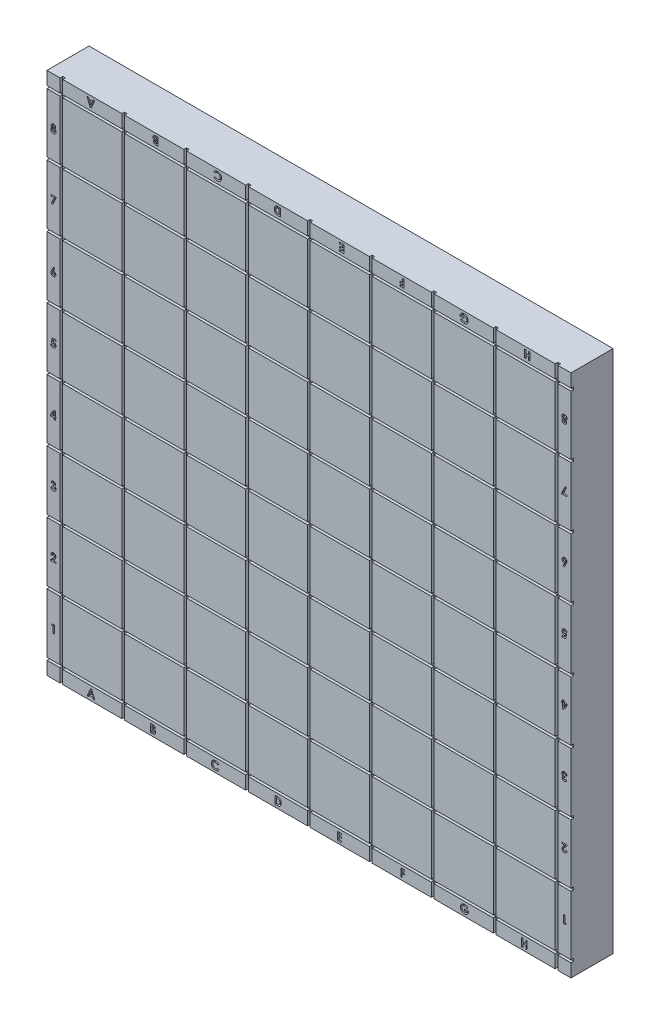
from build123d import *

# Parameters (mm, degrees)
SZKIC3_W                    = 45
SZKIC3_H                    = 45
SZKIC3_H_2                  = 10
SZKIC3_W_2                  = 10
DODANIE_WYCI_GNI_CIE3_DEPTH = 2
SZKIC4_W                    = 398
SZKIC4_H                    = 398
DODANIE_WYCI_GNI_CIE4_DEPTH = 30
SKORUPA1_T                  = -4
DODANIE_WYCI_GNI_CIE5_DEPTH = 26
DODANIE_WYCI_GNI_CIE7_DEPTH = 390
WYTNIJ_WYCI_GNI_CIE2_DEPTH  = 2
SZKIC10_W                   = 40
SZKIC10_H                   = 40
WYTNIJ_WYCI_GNI_CIE4_DEPTH  = 1


with BuildPart() as part:
    # Szkic3 → Dodanie-wyciągnięcie3 (new body)
    with BuildSketch(Plane.XY):
        with Locations((270.095631957, 2748.260182676)):
            Rectangle(SZKIC3_W, SZKIC3_H)
        with Locations((223.095631957, 2748.260182676)):
            Rectangle(SZKIC3_W, SZKIC3_H)
        with Locations((317.095631957, 2748.260182676)):
            Rectangle(SZKIC3_W, SZKIC3_H)
        with Locations((364.095631957, 2748.260182676)):
            Rectangle(SZKIC3_W, SZKIC3_H)
        with Locations((411.095631957, 2748.260182676)):
            Rectangle(SZKIC3_W, SZKIC3_H)
        with Locations((458.095631957, 2748.260182676)):
            Rectangle(SZKIC3_W, SZKIC3_H)
        with Locations((505.095631957, 2748.260182676)):
            Rectangle(SZKIC3_W, SZKIC3_H)
        with Locations((552.095631957, 2748.260182676)):
            Rectangle(SZKIC3_W, SZKIC3_H)
        with Locations((270.095631957, 2701.260182676)):
            Rectangle(SZKIC3_W, SZKIC3_H)
        with Locations((317.095631957, 2701.260182676)):
            Rectangle(SZKIC3_W, SZKIC3_H)
        with Locations((364.095631957, 2701.260182676)):
            Rectangle(SZKIC3_W, SZKIC3_H)
        with Locations((411.095631957, 2701.260182676)):
            Rectangle(SZKIC3_W, SZKIC3_H)
        with Locations((458.095631957, 2701.260182676)):
            Rectangle(SZKIC3_W, SZKIC3_H)
        with Locations((505.095631957, 2701.260182676)):
            Rectangle(SZKIC3_W, SZKIC3_H)
        with Locations((552.095631957, 2701.260182676)):
            Rectangle(SZKIC3_W, SZKIC3_H)
        with Locations((270.095631957, 2654.260182676)):
            Rectangle(SZKIC3_W, SZKIC3_H)
        with Locations((317.095631957, 2654.260182676)):
            Rectangle(SZKIC3_W, SZKIC3_H)
        with Locations((364.095631957, 2654.260182676)):
            Rectangle(SZKIC3_W, SZKIC3_H)
        with Locations((411.095631957, 2654.260182676)):
            Rectangle(SZKIC3_W, SZKIC3_H)
        with Locations((458.095631957, 2654.260182676)):
            Rectangle(SZKIC3_W, SZKIC3_H)
        with Locations((505.095631957, 2654.260182676)):
            Rectangle(SZKIC3_W, SZKIC3_H)
        with Locations((552.095631957, 2654.260182676)):
            Rectangle(SZKIC3_W, SZKIC3_H)
        with Locations((270.095631957, 2607.260182676)):
            Rectangle(SZKIC3_W, SZKIC3_H)
        with Locations((317.095631957, 2607.260182676)):
            Rectangle(SZKIC3_W, SZKIC3_H)
        with Locations((364.095631957, 2607.260182676)):
            Rectangle(SZKIC3_W, SZKIC3_H)
        with Locations((411.095631957, 2607.260182676)):
            Rectangle(SZKIC3_W, SZKIC3_H)
        with Locations((458.095631957, 2607.260182676)):
            Rectangle(SZKIC3_W, SZKIC3_H)
        with Locations((505.095631957, 2607.260182676)):
            Rectangle(SZKIC3_W, SZKIC3_H)
        with Locations((552.095631957, 2607.260182676)):
            Rectangle(SZKIC3_W, SZKIC3_H)
        with Locations((270.095631957, 2560.260182676)):
            Rectangle(SZKIC3_W, SZKIC3_H)
        with Locations((317.095631957, 2560.260182676)):
            Rectangle(SZKIC3_W, SZKIC3_H)
        with Locations((364.095631957, 2560.260182676)):
            Rectangle(SZKIC3_W, SZKIC3_H)
        with Locations((411.095631957, 2560.260182676)):
            Rectangle(SZKIC3_W, SZKIC3_H)
        with Locations((458.095631957, 2560.260182676)):
            Rectangle(SZKIC3_W, SZKIC3_H)
        with Locations((505.095631957, 2560.260182676)):
            Rectangle(SZKIC3_W, SZKIC3_H)
        with Locations((552.095631957, 2560.260182676)):
            Rectangle(SZKIC3_W, SZKIC3_H)
        with Locations((270.095631957, 2513.260182676)):
            Rectangle(SZKIC3_W, SZKIC3_H)
        with Locations((317.095631957, 2513.260182676)):
            Rectangle(SZKIC3_W, SZKIC3_H)
        with Locations((364.095631957, 2513.260182676)):
            Rectangle(SZKIC3_W, SZKIC3_H)
        with Locations((411.095631957, 2513.260182676)):
            Rectangle(SZKIC3_W, SZKIC3_H)
        with Locations((458.095631957, 2513.260182676)):
            Rectangle(SZKIC3_W, SZKIC3_H)
        with Locations((505.095631957, 2513.260182676)):
            Rectangle(SZKIC3_W, SZKIC3_H)
        with Locations((552.095631957, 2513.260182676)):
            Rectangle(SZKIC3_W, SZKIC3_H)
        with Locations((270.095631957, 2466.260182676)):
            Rectangle(SZKIC3_W, SZKIC3_H)
        with Locations((317.095631957, 2466.260182676)):
            Rectangle(SZKIC3_W, SZKIC3_H)
        with Locations((364.095631957, 2466.260182676)):
            Rectangle(SZKIC3_W, SZKIC3_H)
        with Locations((411.095631957, 2466.260182676)):
            Rectangle(SZKIC3_W, SZKIC3_H)
        with Locations((458.095631957, 2466.260182676)):
            Rectangle(SZKIC3_W, SZKIC3_H)
        with Locations((505.095631957, 2466.260182676)):
            Rectangle(SZKIC3_W, SZKIC3_H)
        with Locations((552.095631957, 2466.260182676)):
            Rectangle(SZKIC3_W, SZKIC3_H)
        with Locations((270.095631957, 2419.260182676)):
            Rectangle(SZKIC3_W, SZKIC3_H)
        with Locations((317.095631957, 2419.260182676)):
            Rectangle(SZKIC3_W, SZKIC3_H)
        with Locations((364.095631957, 2419.260182676)):
            Rectangle(SZKIC3_W, SZKIC3_H)
        with Locations((411.095631957, 2419.260182676)):
            Rectangle(SZKIC3_W, SZKIC3_H)
        with Locations((458.095631957, 2419.260182676)):
            Rectangle(SZKIC3_W, SZKIC3_H)
        with Locations((505.095631957, 2419.260182676)):
            Rectangle(SZKIC3_W, SZKIC3_H)
        with Locations((552.095631957, 2419.260182676)):
            Rectangle(SZKIC3_W, SZKIC3_H)
        with Locations((223.095631957, 2701.260182676)):
            Rectangle(SZKIC3_W, SZKIC3_H)
        with Locations((223.095631957, 2654.260182676)):
            Rectangle(SZKIC3_W, SZKIC3_H)
        with Locations((223.095631957, 2607.260182676)):
            Rectangle(SZKIC3_W, SZKIC3_H)
        with Locations((223.095631957, 2560.260182676)):
            Rectangle(SZKIC3_W, SZKIC3_H)
        with Locations((223.095631957, 2513.260182676)):
            Rectangle(SZKIC3_W, SZKIC3_H)
        with Locations((223.095631957, 2466.260182676)):
            Rectangle(SZKIC3_W, SZKIC3_H)
        with Locations((223.095631957, 2419.260182676)):
            Rectangle(SZKIC3_W, SZKIC3_H)
        with Locations((223.095631957, 2777.760182676)):
            Rectangle(SZKIC3_W, SZKIC3_H_2)
        with Locations((193.595631957, 2777.760182676)):
            Rectangle(SZKIC3_W_2, SZKIC3_H_2)
        with Locations((193.595631957, 2748.260182676)):
            Rectangle(SZKIC3_W_2, SZKIC3_H)
        with Locations((270.095631957, 2777.760182676)):
            Rectangle(SZKIC3_W, SZKIC3_H_2)
        with Locations((317.095631957, 2777.760182676)):
            Rectangle(SZKIC3_W, SZKIC3_H_2)
        with Locations((364.095631957, 2777.760182676)):
            Rectangle(SZKIC3_W, SZKIC3_H_2)
        with Locations((411.095631957, 2777.760182676)):
            Rectangle(SZKIC3_W, SZKIC3_H_2)
        with Locations((458.095631957, 2777.760182676)):
            Rectangle(SZKIC3_W, SZKIC3_H_2)
        with Locations((505.095631957, 2777.760182676)):
            Rectangle(SZKIC3_W, SZKIC3_H_2)
        with Locations((552.095631957, 2777.760182676)):
            Rectangle(SZKIC3_W, SZKIC3_H_2)
        with Locations((270.095631957, 2389.760182676)):
            Rectangle(SZKIC3_W, SZKIC3_H_2)
        with Locations((317.095631957, 2389.760182676)):
            Rectangle(SZKIC3_W, SZKIC3_H_2)
        with Locations((364.095631957, 2389.760182676)):
            Rectangle(SZKIC3_W, SZKIC3_H_2)
        with Locations((411.095631957, 2389.760182676)):
            Rectangle(SZKIC3_W, SZKIC3_H_2)
        with Locations((458.095631957, 2389.760182676)):
            Rectangle(SZKIC3_W, SZKIC3_H_2)
        with Locations((505.095631957, 2389.760182676)):
            Rectangle(SZKIC3_W, SZKIC3_H_2)
        with Locations((552.095631957, 2389.760182676)):
            Rectangle(SZKIC3_W, SZKIC3_H_2)
        with Locations((223.095631957, 2389.760182676)):
            Rectangle(SZKIC3_W, SZKIC3_H_2)
        with Locations((581.595631957, 2748.260182676)):
            Rectangle(SZKIC3_W_2, SZKIC3_H)
        with Locations((581.595631957, 2701.260182676)):
            Rectangle(SZKIC3_W_2, SZKIC3_H)
        with Locations((581.595631957, 2654.260182676)):
            Rectangle(SZKIC3_W_2, SZKIC3_H)
        with Locations((581.595631957, 2607.260182676)):
            Rectangle(SZKIC3_W_2, SZKIC3_H)
        with Locations((581.595631957, 2560.260182676)):
            Rectangle(SZKIC3_W_2, SZKIC3_H)
        with Locations((581.595631957, 2513.260182676)):
            Rectangle(SZKIC3_W_2, SZKIC3_H)
        with Locations((581.595631957, 2466.260182676)):
            Rectangle(SZKIC3_W_2, SZKIC3_H)
        with Locations((581.595631957, 2419.260182676)):
            Rectangle(SZKIC3_W_2, SZKIC3_H)
        with Locations((193.595631957, 2701.260182676)):
            Rectangle(SZKIC3_W_2, SZKIC3_H)
        with Locations((193.595631957, 2654.260182676)):
            Rectangle(SZKIC3_W_2, SZKIC3_H)
        with Locations((193.595631957, 2607.260182676)):
            Rectangle(SZKIC3_W_2, SZKIC3_H)
        with Locations((193.595631957, 2560.260182676)):
            Rectangle(SZKIC3_W_2, SZKIC3_H)
        with Locations((193.595631957, 2513.260182676)):
            Rectangle(SZKIC3_W_2, SZKIC3_H)
        with Locations((193.595631957, 2466.260182676)):
            Rectangle(SZKIC3_W_2, SZKIC3_H)
        with Locations((193.595631957, 2419.260182676)):
            Rectangle(SZKIC3_W_2, SZKIC3_H)
        with Locations((581.595631957, 2777.760182676)):
            Rectangle(SZKIC3_W_2, SZKIC3_H_2)
        with Locations((581.595631957, 2389.760182676)):
            Rectangle(SZKIC3_W_2, SZKIC3_H_2)
        with Locations((193.595631957, 2389.760182676)):
            Rectangle(SZKIC3_W_2, SZKIC3_H_2)
    extrude(amount=-DODANIE_WYCI_GNI_CIE3_DEPTH)

    # Szkic4 → Dodanie-wyciągnięcie4 (add)
    with BuildSketch(Plane(origin=(0, 0, -2), x_dir=(-1, 0, 0), z_dir=(0, 0, -1))):
        with Locations((-387.595631957, 2583.760182676)):
            Rectangle(SZKIC4_W, SZKIC4_H)
    extrude(amount=DODANIE_WYCI_GNI_CIE4_DEPTH)

    # Skorupa1
    skorupa1_openings = [part.faces().sort_by_distance(p)[0] for p in [
        (387.595631957, 2583.760182676, -32),
    ]]
    offset(amount=SKORUPA1_T, openings=skorupa1_openings, kind=Kind.INTERSECTION)

    # Szkic5 → Dodanie-wyciągnięcie5 (add)
    with BuildSketch(Plane(origin=(0, 0, -6), x_dir=(-1, 0, 0), z_dir=(0, 0, -1))):
        Polygon((-372.595631957, 2388.760182676), (-402.595631957, 2388.760182676), (-402.595631957, 2563.760182676), (-582.595631957, 2563.760182676), (-582.595631957, 2603.760182676), (-402.595631957, 2603.760182676), (-402.595631957, 2778.760182676), (-372.595631957, 2778.760182676), (-372.595631957, 2603.760182676), (-192.595631957, 2603.760182676), (-192.595631957, 2563.760182676), (-372.595631957, 2563.760182676), align=None)
    extrude(amount=DODANIE_WYCI_GNI_CIE5_DEPTH)

    # Szkic6 → Dodanie-wyciągnięcie7 (add)
    with BuildSketch(Plane.ZY.offset(-582.595631957)):
        Polygon((-2, 2772.760182676), (-2, 2782.760182676), (-6, 2782.760182676), (-6, 2384.760182676), (-2, 2384.760182676), align=None)
    extrude(amount=DODANIE_WYCI_GNI_CIE7_DEPTH)

    # Szkic7 → Wytnij-wyciągnięcie2 (cut)
    # profile 1 of 32: a face of its own
    with BuildSketch(Plane.XY):
        Polygon((221.59683388, 2392.610182676), (222.595631957, 2392.610182676), (225.01870888, 2386.610182676), (223.868468495, 2386.610182676), (223.402122341, 2387.840951907), (220.787939649, 2387.840951907), (220.321593495, 2386.610182676), (219.172555034, 2386.610182676), align=None)
        Polygon((222.095631957, 2391.000807676), (221.196593495, 2388.917874984), (222.994670418, 2388.917874984), align=None, mode=Mode.SUBTRACT)
    # profile 2 of 32: a face of its own
    with BuildSketch(Plane.XY):
        with BuildLine():
            Line((267.441785803, 2386.610182676), (267.441785803, 2392.610182676))
            Line((267.441785803, 2392.610182676), (268.403324264, 2392.610182676))
            add(Edge.make_bspline(
                [(268.403324264, 2392.610182676), (268.470637969, 2392.610190359), (268.600888711, 2392.610205223), (268.78880654, 2392.603606166), (268.963084455, 2392.595069546), (269.123167839, 2392.585519054), (269.269329162, 2392.569061648), (269.401346164, 2392.551717339), (269.519482615, 2392.530801171), (269.592519964, 2392.512038721), (269.626881957, 2392.503211522)],
                knots=[0, 0, 0, 0, 1.311965854, 2.538629056, 3.664479157, 4.713267157, 5.663616078, 6.530575999, 7.308677837, 8, 8, 8, 8], degree=3))
            add(Edge.make_bspline(
                [(269.626881957, 2392.503211522), (269.672002743, 2392.490760601), (269.76054421, 2392.466327897), (269.887363846, 2392.416984996), (270.007669961, 2392.362136862), (270.121315665, 2392.299565399), (270.227603127, 2392.228515195), (270.32612842, 2392.148422374), (270.41901649, 2392.062501858), (270.502969093, 2391.968359067), (270.578848414, 2391.868879769), (270.64477394, 2391.76409003), (270.702054772, 2391.655592155), (270.747894441, 2391.542020769), (270.782433771, 2391.423898899), (270.807695693, 2391.301730945), (270.824068839, 2391.175130336), (270.825615886, 2391.088999804), (270.826401188, 2391.04527883)],
                knots=[0, 0, 0, 0, 1.099996261, 2.158545794, 3.195537121, 4.207578794, 5.205712374, 6.197378256, 7.190519799, 8.17788031, 9.159561366, 10.129234751, 11.085776129, 12.040971148, 13.00380137, 13.975669004, 14.972423361, 16, 16, 16, 16], degree=3))
            add(Edge.make_bspline(
                [(270.826401188, 2391.04527883), (270.824347858, 2390.989108855), (270.82030613, 2390.87854516), (270.7944873, 2390.716147095), (270.746072971, 2390.562657582), (270.682723999, 2390.415247866), (270.596589203, 2390.274467788), (270.48721467, 2390.140384283), (270.35637191, 2390.008868721), (270.25600829, 2389.930034012), (270.203805034, 2389.88902883)],
                knots=[0, 0, 0, 0, 0.986156485, 1.941127874, 2.875419072, 3.804401753, 4.751181392, 5.761612777, 6.835722519, 8, 8, 8, 8], degree=3))
            add(Edge.make_bspline(
                [(270.203805034, 2389.88902883), (270.246108048, 2389.867433508), (270.329052557, 2389.825091056), (270.44680939, 2389.755492705), (270.555839364, 2389.681466031), (270.656631336, 2389.604500482), (270.747071078, 2389.521333376), (270.830892999, 2389.436756916), (270.903961761, 2389.345925222), (270.96930205, 2389.252075709), (271.026094767, 2389.153849425), (271.075554962, 2389.051412253), (271.117332214, 2388.944414245), (271.152710271, 2388.833399933), (271.179095236, 2388.71798748), (271.196298794, 2388.598135611), (271.209470913, 2388.474253081), (271.210495581, 2388.389867395), (271.211016572, 2388.346961522)],
                knots=[0, 0, 0, 0, 1.164658916, 2.283573913, 3.35186032, 4.395461096, 5.390182219, 6.362969632, 7.312859996, 8.245001507, 9.165155236, 10.092416118, 11.032087915, 11.979892451, 12.947605196, 13.931445124, 14.948243989, 16, 16, 16, 16], degree=3))
            add(Edge.make_bspline(
                [(271.211016572, 2388.346961522), (271.207635685, 2388.265013759), (271.200963517, 2388.103290176), (271.152179881, 2387.865842813), (271.067604558, 2387.640721177), (270.954037339, 2387.428819997), (270.814100674, 2387.236273465), (270.653213639, 2387.067604374), (270.472995997, 2386.924829733), (270.30672344, 2386.828467926), (270.162910773, 2386.763800143), (270.043793427, 2386.723818441), (269.915863923, 2386.686779454), (269.776778898, 2386.660769911), (269.629059776, 2386.636963118), (269.471266285, 2386.622264311), (269.303693338, 2386.612303292), (269.188596994, 2386.610903839), (269.129285803, 2386.610182676)],
                knots=[0, 0, 0, 0, 1.284142165, 2.534249414, 3.780121997, 5.041676246, 6.291546858, 7.49970053, 8.684500223, 9.883330709, 10.50184324, 11.153274765, 11.851151195, 12.587658647, 13.369265475, 14.195992086, 15.070362669, 16, 16, 16, 16], degree=3))
            Line((269.129285803, 2386.610182676), (267.441785803, 2386.610182676))
        make_face()
        with BuildLine():
            Line((268.51870888, 2391.533259599), (268.51870888, 2390.225567292))
            Line((268.51870888, 2390.225567292), (268.804766572, 2390.225567292))
            add(Edge.make_bspline(
                [(268.804766572, 2390.225567292), (268.843644383, 2390.225906321), (268.918695643, 2390.226560796), (269.027099228, 2390.234990212), (269.127897055, 2390.249371319), (269.22070682, 2390.269436581), (269.30639308, 2390.294916537), (269.384408447, 2390.325574413), (269.4544099, 2390.362980353), (269.535735398, 2390.418698152), (269.621702314, 2390.500689387), (269.697378024, 2390.619142715), (269.741950511, 2390.755363591), (269.746914684, 2390.8514371), (269.749478111, 2390.901048061)],
                knots=[0, 0, 0, 0, 1.065314748, 2.056525647, 2.977365736, 3.853934255, 4.656397591, 5.425096493, 6.14721249, 6.826394842, 8.123232004, 9.372140726, 10.643011755, 12, 12, 12, 12], degree=3))
            add(Edge.make_bspline(
                [(269.749478111, 2390.901048061), (269.7474269, 2390.947516968), (269.743460967, 2391.037362733), (269.698582203, 2391.163514189), (269.62887661, 2391.275310197), (269.546579359, 2391.351825422), (269.469080507, 2391.404083065), (269.402721233, 2391.438492498), (269.329886948, 2391.46929547), (269.249167656, 2391.492848173), (269.16102431, 2391.510521293), (269.065885071, 2391.523500082), (268.963585792, 2391.532333999), (268.892927461, 2391.532944448), (268.856449264, 2391.533259599)],
                knots=[0, 0, 0, 0, 1.347982417, 2.606269829, 3.849316587, 5.153353503, 5.842674298, 6.568177932, 7.326619318, 8.142485038, 9.012069166, 9.942760135, 10.937925643, 12, 12, 12, 12], degree=3))
            Line((268.856449264, 2391.533259599), (268.51870888, 2391.533259599))
        make_face(mode=Mode.SUBTRACT)
        with BuildLine():
            Line((268.51870888, 2389.225567292), (268.51870888, 2387.687105753))
            Line((268.51870888, 2387.687105753), (268.828805034, 2387.687105753))
            add(Edge.make_bspline(
                [(268.828805034, 2387.687105753), (268.890111438, 2387.687455994), (269.007980651, 2387.688129377), (269.176828089, 2387.696265438), (269.330352622, 2387.710929255), (269.468147468, 2387.729235848), (269.590423686, 2387.75403842), (269.696767953, 2387.78557171), (269.788638643, 2387.820263822), (269.865484894, 2387.8631127), (269.928263879, 2387.912978168), (269.98491533, 2387.963941873), (270.031105394, 2388.022733323), (270.067651834, 2388.086828762), (270.099282714, 2388.154636014), (270.118360227, 2388.228802928), (270.132885175, 2388.307131373), (270.133684522, 2388.361309465), (270.134093495, 2388.38902883)],
                knots=[0, 0, 0, 0, 1.753078804, 3.370512758, 4.83203934, 6.162291463, 7.344201807, 8.395507345, 9.331626367, 10.147333109, 10.898971645, 11.62040215, 12.321813352, 13.025280112, 13.727906689, 14.453419512, 15.208716525, 16, 16, 16, 16], degree=3))
            add(Edge.make_bspline(
                [(270.134093495, 2388.38902883), (270.133191592, 2388.42072636), (270.131434927, 2388.482464621), (270.117088224, 2388.572701678), (270.091015579, 2388.656943958), (270.058175809, 2388.737345649), (270.012477525, 2388.811028092), (269.958166677, 2388.880541156), (269.892545307, 2388.943530914), (269.818750248, 2389.003807222), (269.732675618, 2389.056582395), (269.634281033, 2389.102374206), (269.523031961, 2389.14061784), (269.398583794, 2389.171067446), (269.261482106, 2389.196909606), (269.110726203, 2389.212340229), (268.947571633, 2389.223816661), (268.8344376, 2389.224970489), (268.775920418, 2389.225567292)],
                knots=[0, 0, 0, 0, 0.845221589, 1.646264278, 2.427170338, 3.19324141, 3.95557735, 4.731569926, 5.540061037, 6.376114724, 7.268642756, 8.224665384, 9.265483498, 10.400594375, 11.639216012, 12.983232105, 14.439614077, 16, 16, 16, 16], degree=3))
            Line((268.775920418, 2389.225567292), (268.51870888, 2389.225567292))
        make_face(mode=Mode.SUBTRACT)
    # profile 3 of 32: a face of its own
    with BuildSketch(Plane.XY):
        with BuildLine():
            Line((319.211016572, 2391.569317292), (318.421353111, 2390.814509599))
            add(Edge.make_bspline(
                [(318.421353111, 2390.814509599), (318.354367423, 2390.883772913), (318.223523388, 2391.019065864), (318.012684408, 2391.198181809), (317.793419546, 2391.347450713), (317.569994161, 2391.473164034), (317.338389479, 2391.568275121), (317.101283481, 2391.637584172), (316.857162175, 2391.679839281), (316.691950264, 2391.684674013), (316.608853111, 2391.687105753)],
                knots=[0, 0, 0, 0, 1.115251505, 2.178435587, 3.19620269, 4.182487026, 5.141301733, 6.088180966, 7.038406374, 8, 8, 8, 8], degree=3))
            add(Edge.make_bspline(
                [(316.608853111, 2391.687105753), (316.539456889, 2391.685184593), (316.402511092, 2391.681393396), (316.201438775, 2391.653600178), (316.009102712, 2391.606336603), (315.824844506, 2391.54119864), (315.649206346, 2391.456913574), (315.481819983, 2391.353546639), (315.323098102, 2391.232031384), (315.175137327, 2391.092996537), (315.039788011, 2390.941090518), (314.920198271, 2390.779007158), (314.820022681, 2390.607117781), (314.737810203, 2390.427163156), (314.673769861, 2390.238310365), (314.628037011, 2390.04068655), (314.601586353, 2389.834056356), (314.597638415, 2389.693590691), (314.595631957, 2389.622201907)],
                knots=[0, 0, 0, 0, 1.035432265, 2.043311493, 3.022114605, 3.98653278, 4.95457646, 5.923598177, 6.917315552, 7.932509744, 8.948865224, 9.949768934, 10.933144597, 11.912367597, 12.897413939, 13.903909035, 14.934704909, 16, 16, 16, 16], degree=3))
            add(Edge.make_bspline(
                [(314.595631957, 2389.622201907), (314.596210195, 2389.572096264), (314.597349915, 2389.473337012), (314.609826163, 2389.327244668), (314.629915864, 2389.185500557), (314.658990639, 2389.048319383), (314.695348931, 2388.915582263), (314.738005486, 2388.786144081), (314.791517507, 2388.661793382), (314.850916657, 2388.541085913), (314.919997184, 2388.427315328), (314.994478737, 2388.318825633), (315.07524182, 2388.216148634), (315.162809541, 2388.119704077), (315.258414307, 2388.030999175), (315.359585088, 2387.947366466), (315.468028496, 2387.87089956), (315.581491886, 2387.799679436), (315.700955438, 2387.737809908), (315.823177829, 2387.681768068), (315.950012197, 2387.636253762), (316.079914257, 2387.59956508), (316.212419786, 2387.568366834), (316.348824809, 2387.549157116), (316.487946868, 2387.534609821), (316.581970028, 2387.533711611), (316.629285803, 2387.533259599)],
                knots=[0, 0, 0, 0, 1.103660481, 2.175337485, 3.227646561, 4.255952547, 5.262355991, 6.258840057, 7.255597736, 8.242457506, 9.22035537, 10.185017736, 11.140346927, 12.096287581, 13.051739095, 14.01125915, 14.986044842, 15.97314143, 16.960198552, 17.947847494, 18.933482797, 19.925264591, 20.920966487, 21.929612487, 22.958107872, 24, 24, 24, 24], degree=3))
            add(Edge.make_bspline(
                [(316.629285803, 2387.533259599), (316.709541489, 2387.53558102), (316.867223043, 2387.540142007), (317.098643395, 2387.575808282), (317.319163936, 2387.634477286), (317.495358793, 2387.70376197), (317.63340281, 2387.772181496), (317.738493679, 2387.835466187), (317.847165828, 2387.906257063), (317.957614306, 2387.987225848), (318.07108144, 2388.077400883), (318.185564271, 2388.178757171), (318.303993583, 2388.287957193), (318.381575451, 2388.365895394), (318.421353111, 2388.405855753)],
                knots=[0, 0, 0, 0, 1.404581149, 2.759636711, 4.088442092, 5.392261763, 6.066678138, 6.783632037, 7.538459478, 8.336747902, 9.180226004, 10.074962426, 11.012997595, 12, 12, 12, 12], degree=3))
            Line((318.421353111, 2388.405855753), (319.186978111, 2387.601769215))
            add(Edge.make_bspline(
                [(319.186978111, 2387.601769215), (319.133158794, 2387.549808354), (319.028114998, 2387.448391867), (318.869659348, 2387.304389919), (318.71140312, 2387.17498816), (318.557169456, 2387.055489874), (318.404431847, 2386.949376337), (318.253206491, 2386.856541571), (318.105205325, 2386.77463765), (317.957355057, 2386.705045846), (317.808735686, 2386.645955176), (317.655823819, 2386.595081987), (317.49815199, 2386.5520451), (317.33475721, 2386.517319984), (317.167163527, 2386.489475129), (316.993802487, 2386.470680013), (316.815773284, 2386.458044682), (316.695013317, 2386.456909293), (316.634093495, 2386.456336522)],
                knots=[0, 0, 0, 0, 1.244526981, 2.429050516, 3.560637417, 4.644440555, 5.67424972, 6.652764056, 7.595344123, 8.486817594, 9.369275933, 10.254498637, 11.166417451, 12.086725134, 13.032340136, 13.991389299, 14.986715468, 16, 16, 16, 16], degree=3))
            add(Edge.make_bspline(
                [(316.634093495, 2386.456336522), (316.522191328, 2386.459189132), (316.303229893, 2386.464770896), (315.982347619, 2386.506127985), (315.677518072, 2386.575462417), (315.387999659, 2386.673520428), (315.11388444, 2386.798784941), (314.855242543, 2386.952353352), (314.61249084, 2387.133817654), (314.387590287, 2387.34105091), (314.184157033, 2387.569922643), (314.004345596, 2387.815668096), (313.855605569, 2388.079495018), (313.732103519, 2388.357505841), (313.63552654, 2388.650969238), (313.567552719, 2388.960202646), (313.52563376, 2389.284907482), (313.521047766, 2389.506688369), (313.51870888, 2389.619798061)],
                knots=[0, 0, 0, 0, 1.078019885, 2.10938526, 3.111377082, 4.085535484, 5.04941344, 6.010039228, 6.978205633, 7.964457913, 8.951525778, 9.924444315, 10.892603023, 11.863865945, 12.85144698, 13.863884204, 14.910567087, 16, 16, 16, 16], degree=3))
            add(Edge.make_bspline(
                [(313.51870888, 2389.619798061), (313.51969718, 2389.693567237), (313.521655749, 2389.839759713), (313.542240493, 2390.055113075), (313.570936823, 2390.265044083), (313.616460942, 2390.467372955), (313.671335777, 2390.664825437), (313.739579843, 2390.855255449), (313.821084147, 2391.039210307), (313.913221612, 2391.216997963), (314.017455804, 2391.387453716), (314.133896839, 2391.549113083), (314.259547071, 2391.703224045), (314.397425671, 2391.847742034), (314.545529081, 2391.983935946), (314.704525972, 2392.111067719), (314.873460056, 2392.230960567), (315.052788576, 2392.340522745), (315.239027656, 2392.439627558), (315.429828331, 2392.527042235), (315.624721827, 2392.600100776), (315.822884115, 2392.66070014), (316.025152428, 2392.705933281), (316.230083028, 2392.740173309), (316.439419628, 2392.759313704), (316.579971019, 2392.762447108), (316.650920418, 2392.76402883)],
                knots=[0, 0, 0, 0, 1.071919942, 2.124283339, 3.142214191, 4.149696895, 5.136002878, 6.119640489, 7.086990633, 8.058538607, 9.028339693, 9.988281803, 10.952401235, 11.916291999, 12.888973767, 13.874849856, 14.873389453, 15.898127285, 16.927174885, 17.938320013, 18.946391617, 19.950418109, 20.947802303, 21.956882652, 22.968648068, 24, 24, 24, 24], degree=3))
            add(Edge.make_bspline(
                [(316.650920418, 2392.76402883), (316.711447531, 2392.763122148), (316.831872442, 2392.76131821), (317.011205343, 2392.746280426), (317.189104024, 2392.722663739), (317.364931552, 2392.687031188), (317.539945626, 2392.644730846), (317.711846364, 2392.589344384), (317.883345595, 2392.527605734), (318.051753606, 2392.453809784), (318.217305472, 2392.373254839), (318.376122878, 2392.281862328), (318.530872354, 2392.185256445), (318.678124746, 2392.07771963), (318.820638407, 2391.963152443), (318.95766812, 2391.841020364), (319.088011371, 2391.709287093), (319.169807558, 2391.616209761), (319.211016572, 2391.569317292)],
                knots=[0, 0, 0, 0, 0.996412454, 1.982464992, 2.961075852, 3.949442424, 4.934965278, 5.923860011, 6.921385422, 7.934793307, 8.949617135, 9.951082467, 10.950285876, 11.951772932, 12.951063433, 13.960125323, 14.972308753, 16, 16, 16, 16], degree=3))
        make_face()
    # profile 4 of 32: a face of its own
    with BuildSketch(Plane.XY):
        with BuildLine():
            Line((361.826401188, 2392.610182676), (363.183372341, 2392.610182676))
            add(Edge.make_bspline(
                [(363.183372341, 2392.610182676), (363.289163851, 2392.609443157), (363.493660034, 2392.608013659), (363.789934548, 2392.591906651), (364.065432145, 2392.567135216), (364.320330415, 2392.533057617), (364.554106776, 2392.487963623), (364.766459778, 2392.431402045), (364.958102128, 2392.366111113), (365.131135146, 2392.289283083), (365.289097649, 2392.19970923), (365.439088087, 2392.099931148), (365.580811956, 2391.986293676), (365.716258129, 2391.860989107), (365.843678643, 2391.721725032), (365.965195506, 2391.570808169), (366.077833433, 2391.406050014), (366.184997227, 2391.231400949), (366.281912618, 2391.046120829), (366.366445844, 2390.851786718), (366.43725984, 2390.649649229), (366.494799879, 2390.439492936), (366.540665931, 2390.222015494), (366.572757482, 2389.996778054), (366.5925968, 2389.763989148), (366.594609332, 2389.606216677), (366.595631957, 2389.526048061)],
                knots=[0, 0, 0, 0, 1.44355588, 2.790409838, 4.047694926, 5.217575253, 6.298404546, 7.294384826, 8.214239204, 9.058592145, 9.873746385, 10.689560431, 11.514393297, 12.350027578, 13.205127629, 14.088021785, 14.991911688, 15.926770944, 16.882954281, 17.842803888, 18.816321264, 19.80318086, 20.814351908, 21.847355356, 22.906180909, 24, 24, 24, 24], degree=3))
            add(Edge.make_bspline(
                [(366.595631957, 2389.526048061), (366.592954174, 2389.412924926), (366.587682802, 2389.190235413), (366.54327971, 2388.863441117), (366.471464876, 2388.550176192), (366.370486696, 2388.252891115), (366.245300785, 2387.974233254), (366.095752195, 2387.719116625), (365.924033658, 2387.488910564), (365.732145705, 2387.284761307), (365.524377786, 2387.109292255), (365.308465021, 2386.959015852), (365.082304027, 2386.840510369), (364.883024584, 2386.765360171), (364.710224446, 2386.71862325), (364.558507794, 2386.69100128), (364.386173157, 2386.665670267), (364.191613666, 2386.646095005), (363.975682809, 2386.628638682), (363.737519884, 2386.619153595), (363.477895994, 2386.611272896), (363.297562655, 2386.610555605), (363.203805034, 2386.610182676)],
                knots=[0, 0, 0, 0, 1.315458931, 2.589557908, 3.828601765, 5.048913369, 6.235739168, 7.376350998, 8.481830359, 9.569842114, 10.627874879, 11.640079404, 12.624025415, 13.590060155, 14.111227486, 14.704434459, 15.382649715, 16.137166398, 16.978595427, 17.902333227, 18.909396075, 20, 20, 20, 20], degree=3))
            Line((363.203805034, 2386.610182676), (361.826401188, 2386.610182676))
            Line((361.826401188, 2386.610182676), (361.826401188, 2392.610182676))
        make_face()
        with BuildLine():
            Line((362.903324264, 2391.533259599), (362.903324264, 2387.687105753))
            Line((362.903324264, 2387.687105753), (363.465824264, 2387.687105753))
            add(Edge.make_bspline(
                [(363.465824264, 2387.687105753), (363.532753126, 2387.687228395), (363.661479607, 2387.687464275), (363.847331507, 2387.698699453), (364.01919739, 2387.709976473), (364.176604151, 2387.731380635), (364.320697345, 2387.755223365), (364.44949751, 2387.788403788), (364.565659778, 2387.823257012), (364.667765248, 2387.867629487), (364.761285539, 2387.917573659), (364.847874646, 2387.976089048), (364.931457378, 2388.04106818), (365.010471087, 2388.114422184), (365.085214822, 2388.195179716), (365.155246352, 2388.283756883), (365.221500411, 2388.379883434), (365.282276384, 2388.484067613), (365.337813793, 2388.595209212), (365.387081699, 2388.712231663), (365.427932063, 2388.836109511), (365.461884384, 2388.96568311), (365.486147168, 2389.102080544), (365.506219993, 2389.244291539), (365.51656812, 2389.39287952), (365.517988335, 2389.493983749), (365.51870888, 2389.54527883)],
                knots=[0, 0, 0, 0, 1.50275155, 2.890291501, 4.180787663, 5.369391935, 6.45668281, 7.458360028, 8.354766181, 9.177074746, 9.954075863, 10.732690366, 11.5210699, 12.329727389, 13.151100085, 13.990027547, 14.863562427, 15.770965086, 16.696477834, 17.652329173, 18.619756807, 19.62365428, 20.657822005, 21.729286259, 22.847956731, 24, 24, 24, 24], degree=3))
            add(Edge.make_bspline(
                [(365.51870888, 2389.54527883), (365.5172738, 2389.623883693), (365.514475505, 2389.777157086), (365.487489358, 2390.000403127), (365.443561059, 2390.210622719), (365.380879608, 2390.40703568), (365.301867697, 2390.590194033), (365.202965871, 2390.75854604), (365.088430485, 2390.914919782), (364.997859027, 2391.006653637), (364.952603111, 2391.052490369)],
                knots=[0, 0, 0, 0, 1.13821349, 2.219428113, 3.251817212, 4.244760574, 5.201143372, 6.134805572, 7.068016741, 8, 8, 8, 8], degree=3))
            add(Edge.make_bspline(
                [(364.952603111, 2391.052490369), (364.907976492, 2391.091549461), (364.816831677, 2391.171323233), (364.656811333, 2391.266912614), (364.480477202, 2391.350897254), (364.283795287, 2391.417487708), (364.068666431, 2391.470150277), (363.833809324, 2391.506470364), (363.580481675, 2391.529809266), (363.404982182, 2391.532084848), (363.314381957, 2391.533259599)],
                knots=[0, 0, 0, 0, 0.813307809, 1.661089106, 2.549956539, 3.493439533, 4.508053171, 5.589449661, 6.755572447, 8, 8, 8, 8], degree=3))
            Line((363.314381957, 2391.533259599), (362.903324264, 2391.533259599))
        make_face(mode=Mode.SUBTRACT)
    # profile 5 of 32: a face of its own
    with BuildSketch(Plane.XY):
        Polygon((409.211016572, 2392.610182676), (412.441785803, 2392.610182676), (412.441785803, 2391.533259599), (410.287939649, 2391.533259599), (410.287939649, 2390.379413446), (412.441785803, 2390.379413446), (412.441785803, 2389.302490369), (410.287939649, 2389.302490369), (410.287939649, 2387.687105753), (412.441785803, 2387.687105753), (412.441785803, 2386.610182676), (409.211016572, 2386.610182676), align=None)
    # profile 6 of 32: a face of its own
    with BuildSketch(Plane.XY):
        Polygon((457.364862726, 2392.610182676), (460.287939649, 2392.610182676), (460.287939649, 2391.533259599), (458.441785803, 2391.533259599), (458.441785803, 2390.379413446), (460.287939649, 2390.379413446), (460.287939649, 2389.302490369), (458.441785803, 2389.302490369), (458.441785803, 2386.610182676), (457.364862726, 2386.610182676), align=None)
    # profile 7 of 32: a face of its own
    with BuildSketch(Plane.XY):
        with BuildLine():
            Line((508.402122341, 2391.655855753), (507.587218495, 2390.875807676))
            add(Edge.make_bspline(
                [(507.587218495, 2390.875807676), (507.522701136, 2390.940402339), (507.396107425, 2391.067147731), (507.189079247, 2391.23211557), (506.974660887, 2391.372370845), (506.752146606, 2391.487698543), (506.521226442, 2391.577156733), (506.282356098, 2391.641149038), (506.035146963, 2391.679103958), (505.867797414, 2391.684417518), (505.783131957, 2391.687105753)],
                knots=[0, 0, 0, 0, 1.075575784, 2.110457258, 3.113929901, 4.09197124, 5.059417775, 6.02750972, 7.002078037, 8, 8, 8, 8], degree=3))
            add(Edge.make_bspline(
                [(505.783131957, 2391.687105753), (505.709729594, 2391.685222119), (505.565597621, 2391.681523438), (505.353809567, 2391.653435908), (505.151433109, 2391.606516952), (504.957512136, 2391.541518572), (504.773230602, 2391.456935137), (504.597520748, 2391.354072093), (504.431463891, 2391.232142528), (504.276367611, 2391.093457804), (504.135151949, 2390.942042086), (504.011863219, 2390.779973726), (503.906847708, 2390.610273541), (503.820398525, 2390.43207332), (503.754620098, 2390.245646564), (503.707662908, 2390.051128611), (503.677856769, 2389.849084756), (503.674337555, 2389.711248346), (503.672555034, 2389.641432676)],
                knots=[0, 0, 0, 0, 1.075001177, 2.110859044, 3.123021556, 4.114053297, 5.101481495, 6.087880186, 7.091499647, 8.114004866, 9.131394192, 10.11971144, 11.092043119, 12.050101265, 13.015322563, 13.981809771, 14.977764287, 16, 16, 16, 16], degree=3))
            add(Edge.make_bspline(
                [(503.672555034, 2389.641432676), (503.674217684, 2389.569200593), (503.677493333, 2389.426893501), (503.708959646, 2389.218051726), (503.757438918, 2389.017130888), (503.828399646, 2388.825621776), (503.915730812, 2388.64090098), (504.026481119, 2388.466546719), (504.15562706, 2388.299896411), (504.302937869, 2388.143851535), (504.463173987, 2388.000015713), (504.636714916, 2387.875939231), (504.818280477, 2387.768888009), (505.010801147, 2387.684106902), (505.210935337, 2387.616036961), (505.420712982, 2387.568041811), (505.639661713, 2387.538596953), (505.789048458, 2387.535056428), (505.864862726, 2387.533259599)],
                knots=[0, 0, 0, 0, 1.022067601, 2.013613092, 2.983553406, 3.943623673, 4.90013463, 5.87121881, 6.861774014, 7.881098904, 8.905697761, 9.905387765, 10.89678721, 11.884561068, 12.87834324, 13.885584958, 14.926927371, 16, 16, 16, 16], degree=3))
            add(Edge.make_bspline(
                [(505.864862726, 2387.533259599), (505.9141771, 2387.533704554), (506.010992187, 2387.5345781), (506.153003423, 2387.548758205), (506.289016077, 2387.569030313), (506.419556889, 2387.595868178), (506.543307746, 2387.633848571), (506.661982065, 2387.678261964), (506.774884519, 2387.730678624), (506.881402961, 2387.792907023), (506.983122697, 2387.862657451), (507.079091608, 2387.942466774), (507.170993102, 2388.030535584), (507.257753323, 2388.127939767), (507.337903828, 2388.235550232), (507.414012437, 2388.351389492), (507.485207718, 2388.476607182), (507.527275132, 2388.565029572), (507.548756957, 2388.610182676)],
                knots=[0, 0, 0, 0, 1.109579412, 2.178351274, 3.208885622, 4.204702371, 5.174744997, 6.119429583, 7.05542196, 7.97267548, 8.893247984, 9.828544973, 10.778894627, 11.756245826, 12.760884819, 13.796418446, 14.874735809, 16, 16, 16, 16], degree=3))
            Line((507.548756957, 2388.610182676), (505.826401188, 2388.610182676))
            Line((505.826401188, 2388.610182676), (505.826401188, 2389.687105753))
            Line((505.826401188, 2389.687105753), (508.817987726, 2389.687105753))
            Line((508.817987726, 2389.687105753), (508.826401188, 2389.431096138))
            add(Edge.make_bspline(
                [(508.826401188, 2389.431096138), (508.82532012, 2389.365346373), (508.823159915, 2389.233964179), (508.803417906, 2389.038358475), (508.770715568, 2388.845347074), (508.726008343, 2388.655123834), (508.669978879, 2388.46675564), (508.598523774, 2388.282046275), (508.514850283, 2388.099743101), (508.421100073, 2387.920620766), (508.315751811, 2387.748748016), (508.202328937, 2387.58600721), (508.082448374, 2387.432680017), (507.953502767, 2387.29090267), (507.817500013, 2387.159484176), (507.674172387, 2387.038930118), (507.523012949, 2386.929138493), (507.364822449, 2386.82918181), (507.198699841, 2386.741575676), (507.025558466, 2386.665369962), (506.845659744, 2386.600650057), (506.658539218, 2386.547593815), (506.464565096, 2386.506656703), (506.263733222, 2386.478586071), (506.055933296, 2386.459511762), (505.914987002, 2386.457407731), (505.843228111, 2386.456336522)],
                knots=[0, 0, 0, 0, 1.006889344, 2.011981806, 3.007738725, 4.003571281, 5.003404394, 6.015442001, 7.03424805, 8.074616296, 9.110249922, 10.119753985, 11.111721717, 12.089233633, 13.052717867, 14.006597561, 14.955430184, 15.912305663, 16.870361111, 17.829300583, 18.807640451, 19.796414044, 20.806216501, 21.841577364, 22.90109906, 24, 24, 24, 24], degree=3))
            add(Edge.make_bspline(
                [(505.843228111, 2386.456336522), (505.766666239, 2386.457394361), (505.614897774, 2386.459491313), (505.390487757, 2386.47913069), (505.172588015, 2386.511544216), (504.961144198, 2386.556403428), (504.755665375, 2386.6122343), (504.556504592, 2386.682315252), (504.364069186, 2386.76567876), (504.177782903, 2386.860117327), (504.000026685, 2386.967218887), (503.831198912, 2387.085105404), (503.672221077, 2387.214535186), (503.521464756, 2387.353341551), (503.382452199, 2387.504936374), (503.25000295, 2387.664405729), (503.130533723, 2387.837598317), (503.018907694, 2388.018899184), (502.91973824, 2388.208232354), (502.833013125, 2388.402096014), (502.759053997, 2388.599367691), (502.700735437, 2388.800965949), (502.653386228, 2389.005485076), (502.61950698, 2389.213814478), (502.600373786, 2389.425928077), (502.597219583, 2389.568479403), (502.595631957, 2389.640230753)],
                knots=[0, 0, 0, 0, 1.084149091, 2.14910686, 3.187506334, 4.202448172, 5.208724393, 6.201130722, 7.189831603, 8.176984443, 9.156919086, 10.126598231, 11.090766514, 12.05840148, 13.026036446, 14.001772938, 14.991905635, 16.003017641, 17.015720547, 18.016462227, 19.009322657, 19.99686681, 20.986544154, 21.980959929, 22.983742515, 24, 24, 24, 24], degree=3))
            add(Edge.make_bspline(
                [(502.595631957, 2389.640230753), (502.597758128, 2389.738114928), (502.601956685, 2389.931407154), (502.6408417, 2390.216127828), (502.701457644, 2390.491566671), (502.788447628, 2390.756720553), (502.900076318, 2391.011954727), (503.034762394, 2391.257868367), (503.19543153, 2391.494200089), (503.319800476, 2391.640522247), (503.382891572, 2391.714749984)],
                knots=[0, 0, 0, 0, 1.034044851, 2.041932006, 3.031217818, 4.011390712, 4.986069675, 5.97149666, 6.970960977, 8, 8, 8, 8], degree=3))
            add(Edge.make_bspline(
                [(503.382891572, 2391.714749984), (503.422064217, 2391.757692979), (503.499821329, 2391.84293418), (503.62411593, 2391.961378561), (503.751562677, 2392.072720662), (503.883926727, 2392.174599543), (504.020512268, 2392.269245381), (504.161712417, 2392.354883964), (504.30678647, 2392.434242071), (504.456865829, 2392.503267375), (504.611164808, 2392.565154319), (504.770366773, 2392.617519374), (504.933279334, 2392.663902367), (505.101345087, 2392.699187929), (505.272866167, 2392.728571052), (505.449060087, 2392.748265159), (505.62944671, 2392.762699538), (505.751451149, 2392.763582228), (505.813180034, 2392.76402883)],
                knots=[0, 0, 0, 0, 1.020590567, 2.025856924, 3.013483481, 3.991664875, 4.957826714, 5.930500614, 6.890802512, 7.860442893, 8.829981142, 9.809047939, 10.802672283, 11.803273349, 12.823572789, 13.857849586, 14.916166035, 16, 16, 16, 16], degree=3))
            add(Edge.make_bspline(
                [(505.813180034, 2392.76402883), (505.877706759, 2392.763033717), (506.006091249, 2392.761053807), (506.196977724, 2392.747354125), (506.385211704, 2392.726218743), (506.569999953, 2392.694514464), (506.751962619, 2392.65541649), (506.930157821, 2392.605322307), (507.105748063, 2392.548406292), (507.220056645, 2392.50302864), (507.277122341, 2392.480374984)],
                knots=[0, 0, 0, 0, 1.03180557, 2.052914215, 3.058998889, 4.059601663, 5.049854447, 6.033765722, 7.018406786, 8, 8, 8, 8], degree=3))
            add(Edge.make_bspline(
                [(507.277122341, 2392.480374984), (507.325136066, 2392.459438928), (507.422794654, 2392.41685557), (507.564875862, 2392.338947318), (507.707304213, 2392.252577079), (507.848542834, 2392.154586957), (507.988376516, 2392.045160239), (508.12826527, 2391.926025301), (508.266781064, 2391.795792961), (508.356424327, 2391.703105584), (508.402122341, 2391.655855753)],
                knots=[0, 0, 0, 0, 0.894392155, 1.819168899, 2.76525314, 3.739198753, 4.75366411, 5.797420238, 6.877176959, 8, 8, 8, 8], degree=3))
        make_face()
    # profile 8 of 32: a face of its own
    with BuildSketch(Plane.XY):
        Polygon((549.134093495, 2392.610182676), (550.211016572, 2392.610182676), (550.211016572, 2390.302490369), (552.287939649, 2390.302490369), (552.287939649, 2392.610182676), (553.364862726, 2392.610182676), (553.364862726, 2386.610182676), (552.287939649, 2386.610182676), (552.287939649, 2389.225567292), (550.211016572, 2389.225567292), (550.211016572, 2386.610182676), (549.134093495, 2386.610182676), align=None)
    # profile 9 of 32: a face of its own
    with BuildSketch(Plane.XY):
        with BuildLine():
            add(Edge.make_bspline(
                [(194.773516572, 2746.990951907), (194.836434129, 2746.945995613), (194.960973757, 2746.857008684), (195.125445049, 2746.697585273), (195.267112172, 2746.519746609), (195.384487466, 2746.32458352), (195.47852501, 2746.116893164), (195.545841625, 2745.898895502), (195.588600365, 2745.672513328), (195.593270896, 2745.518386031), (195.595631957, 2745.440471138)],
                knots=[0, 0, 0, 0, 1.013736912, 2.006600758, 2.994453809, 3.989973287, 4.987781207, 5.978959008, 6.978317308, 8, 8, 8, 8], degree=3))
            add(Edge.make_bspline(
                [(195.595631957, 2745.440471138), (195.592783517, 2745.356103023), (195.587134001, 2745.188769695), (195.537184736, 2744.943375396), (195.456993195, 2744.707622247), (195.347395805, 2744.484112366), (195.209980834, 2744.279791584), (195.049810906, 2744.098909465), (194.866684113, 2743.946190057), (194.696187882, 2743.842570923), (194.54943582, 2743.773738692), (194.431008193, 2743.729687446), (194.305956404, 2743.690906487), (194.1733881, 2743.659923075), (194.033327388, 2743.635735437), (193.885974151, 2743.619761965), (193.73123139, 2743.608150225), (193.625703369, 2743.606951284), (193.571593495, 2743.606336522)],
                knots=[0, 0, 0, 0, 1.313679292, 2.605514271, 3.884962679, 5.186178731, 6.472827995, 7.711026938, 8.938935107, 10.174644318, 10.808706728, 11.462743532, 12.142127587, 12.847854939, 13.582806024, 14.355735269, 15.156897313, 16, 16, 16, 16], degree=3))
            add(Edge.make_bspline(
                [(193.571593495, 2743.606336522), (193.513890682, 2743.607119236), (193.401208466, 2743.608647722), (193.23671753, 2743.617889755), (193.081553984, 2743.63492848), (192.935392344, 2743.657358642), (192.798373235, 2743.687040247), (192.670492598, 2743.724674897), (192.55144165, 2743.767526133), (192.405717037, 2743.832770817), (192.239180231, 2743.934664364), (192.059184059, 2744.083884524), (191.901193473, 2744.261610398), (191.76383562, 2744.462853246), (191.655564983, 2744.686375022), (191.575051711, 2744.925160105), (191.527370798, 2745.178561419), (191.521630549, 2745.35212886), (191.51870888, 2745.440471138)],
                knots=[0, 0, 0, 0, 0.886964665, 1.7320671, 2.531131818, 3.285397207, 4.004107883, 4.684213108, 5.332925796, 5.947568694, 7.135706876, 8.320776993, 9.52873045, 10.778999824, 12.05415135, 13.333578234, 14.642845846, 16, 16, 16, 16], degree=3))
            add(Edge.make_bspline(
                [(191.51870888, 2745.440471138), (191.521378796, 2745.517535243), (191.526625504, 2745.668975539), (191.564208385, 2745.89088347), (191.628651605, 2746.101278444), (191.717077733, 2746.301625147), (191.831101724, 2746.491945871), (191.97139785, 2746.670840229), (192.136187296, 2746.839922099), (192.261150213, 2746.939773582), (192.325199264, 2746.990951907)],
                knots=[0, 0, 0, 0, 1.01821053, 2.000906977, 2.963938143, 3.919209931, 4.888045165, 5.887808425, 6.917407893, 8, 8, 8, 8], degree=3))
            add(Edge.make_bspline(
                [(192.325199264, 2746.990951907), (192.28549225, 2747.036748139), (192.207321096, 2747.126907128), (192.106166854, 2747.272010836), (192.020948665, 2747.42161291), (191.948594365, 2747.574499252), (191.895108222, 2747.733302183), (191.854660367, 2747.895524995), (191.8317831, 2748.062820368), (191.828207314, 2748.17558242), (191.826401188, 2748.232538446)],
                knots=[0, 0, 0, 0, 1.061529281, 2.089831458, 3.092927091, 4.075998741, 5.048384512, 6.024008542, 7.00192825, 8, 8, 8, 8], degree=3))
            add(Edge.make_bspline(
                [(191.826401188, 2748.232538446), (191.828795837, 2748.309640113), (191.833520388, 2748.461758732), (191.875365459, 2748.684192069), (191.944838438, 2748.895548072), (192.039350513, 2749.095207923), (192.15936616, 2749.278820248), (192.301970732, 2749.443479459), (192.469168968, 2749.583154151), (192.654743215, 2749.703001202), (192.85962366, 2749.798326435), (193.081866417, 2749.865027894), (193.318787872, 2749.907253434), (193.482067067, 2749.911736008), (193.56558388, 2749.91402883)],
                knots=[0, 0, 0, 0, 1.022455555, 2.017265428, 2.990720743, 3.968117071, 4.939886797, 5.893155559, 6.847550415, 7.820889576, 8.817530429, 9.83499769, 10.892607882, 12, 12, 12, 12], degree=3))
            add(Edge.make_bspline(
                [(193.56558388, 2749.91402883), (193.647897833, 2749.911732255), (193.808392806, 2749.907254415), (194.041150683, 2749.865308662), (194.258590731, 2749.797121416), (194.458914879, 2749.699783441), (194.642569928, 2749.579705399), (194.806926502, 2749.435167364), (194.949083577, 2749.266407049), (195.07009543, 2749.078044726), (195.166523282, 2748.875111616), (195.237812052, 2748.66229412), (195.279046319, 2748.441265005), (195.284963351, 2748.291196665), (195.287939649, 2748.215711522)],
                knots=[0, 0, 0, 0, 1.094655142, 2.134348324, 3.136019022, 4.118575226, 5.088726318, 6.048298823, 7.020513804, 8.015920439, 9.020015034, 10.003048569, 10.995523219, 12, 12, 12, 12], degree=3))
            add(Edge.make_bspline(
                [(195.287939649, 2748.215711522), (195.286505895, 2748.162362706), (195.28369226, 2748.057669642), (195.262888808, 2747.903427213), (195.227858348, 2747.755431395), (195.179017956, 2747.610105738), (195.111113139, 2747.463500933), (195.019222132, 2747.312807766), (194.907448789, 2747.151764908), (194.819667599, 2747.046365647), (194.773516572, 2746.990951907)],
                knots=[0, 0, 0, 0, 0.940746401, 1.846144481, 2.739104268, 3.619506754, 4.545839139, 5.581956076, 6.728711598, 8, 8, 8, 8], degree=3))
        make_face()
        with BuildLine():
            add(Edge.make_bspline(
                [(193.539141572, 2748.837105753), (193.4948024, 2748.834968195), (193.408552914, 2748.830810171), (193.285484998, 2748.793279405), (193.174842925, 2748.731895168), (193.079152321, 2748.647418378), (193.000681037, 2748.544918447), (192.943008954, 2748.427073832), (192.908808728, 2748.295338866), (192.905187969, 2748.203095546), (192.903324264, 2748.155615369)],
                knots=[0, 0, 0, 0, 1.018099191, 1.980427864, 2.929421084, 3.909248076, 4.895556904, 5.880788387, 6.909183412, 8, 8, 8, 8], degree=3))
            add(Edge.make_bspline(
                [(192.903324264, 2748.155615369), (192.905626509, 2748.107729701), (192.910121864, 2748.014228319), (192.94547278, 2747.879962296), (193.005729392, 2747.758279096), (193.088461314, 2747.651720283), (193.188993997, 2747.564686126), (193.301559783, 2747.498214281), (193.427407047, 2747.460267228), (193.514858819, 2747.455121473), (193.559574264, 2747.452490369)],
                knots=[0, 0, 0, 0, 1.07118507, 2.091592095, 3.082435519, 4.092579768, 5.090825648, 6.043203473, 6.999459622, 8, 8, 8, 8], degree=3))
            add(Edge.make_bspline(
                [(193.559574264, 2747.452490369), (193.605135079, 2747.454529023), (193.693896094, 2747.458500705), (193.820057582, 2747.497432378), (193.93371296, 2747.559695654), (194.031041999, 2747.647722152), (194.111660343, 2747.754319556), (194.170372821, 2747.878129276), (194.204165602, 2748.016825088), (194.208677058, 2748.113760728), (194.211016572, 2748.16402883)],
                knots=[0, 0, 0, 0, 1.008803858, 1.965339183, 2.900766489, 3.864508618, 4.855158575, 5.849593072, 6.884859315, 8, 8, 8, 8], degree=3))
            add(Edge.make_bspline(
                [(194.211016572, 2748.16402883), (194.208617878, 2748.21147762), (194.203978887, 2748.303241912), (194.170715547, 2748.434985424), (194.109625758, 2748.550990765), (194.029361658, 2748.652854192), (193.928731987, 2748.73500071), (193.811908309, 2748.795411755), (193.679750866, 2748.830450746), (193.587026305, 2748.834839379), (193.539141572, 2748.837105753)],
                knots=[0, 0, 0, 0, 1.065910571, 2.061433587, 3.023559535, 3.990682701, 4.956464619, 5.918590567, 6.925120432, 8, 8, 8, 8], degree=3))
        make_face(mode=Mode.SUBTRACT)
        with BuildLine():
            add(Edge.make_bspline(
                [(193.573997341, 2746.375567292), (193.540302927, 2746.375007746), (193.473891657, 2746.373904888), (193.376261633, 2746.36118728), (193.282575592, 2746.3422349), (193.192949766, 2746.316090625), (193.107836938, 2746.2804494), (193.026515637, 2746.237483244), (192.949266707, 2746.186757825), (192.877235967, 2746.129194062), (192.812137009, 2746.066012347), (192.753456221, 2746.000115867), (192.705492961, 2745.929801019), (192.665551001, 2745.857405091), (192.63345741, 2745.782354384), (192.612241121, 2745.703412968), (192.598580801, 2745.621632121), (192.596620688, 2745.565926324), (192.595631957, 2745.537826907)],
                knots=[0, 0, 0, 0, 1.129580664, 2.226389355, 3.296443603, 4.333934503, 5.352185725, 6.386189251, 7.41493955, 8.447544828, 9.47401038, 10.455044306, 11.4018853, 12.322125673, 13.225630306, 14.132028716, 15.057747923, 16, 16, 16, 16], degree=3))
            add(Edge.make_bspline(
                [(192.595631957, 2745.537826907), (192.596103203, 2745.50852199), (192.597037863, 2745.450399314), (192.611154581, 2745.365564573), (192.631480163, 2745.283747291), (192.660028092, 2745.205713327), (192.698205523, 2745.131508114), (192.743790068, 2745.060410215), (192.798371243, 2744.992918181), (192.860469096, 2744.92939388), (192.929987367, 2744.872083621), (193.004912828, 2744.821592285), (193.084255885, 2744.777076539), (193.17039836, 2744.745014534), (193.260150054, 2744.715668571), (193.355915442, 2744.697865082), (193.456648553, 2744.684764781), (193.525472116, 2744.683769925), (193.560776188, 2744.683259599)],
                knots=[0, 0, 0, 0, 0.973817353, 1.931446211, 2.852767904, 3.776304432, 4.688323523, 5.623710549, 6.581246645, 7.570897993, 8.57436511, 9.572506873, 10.574556662, 11.591826551, 12.624694332, 13.712108235, 14.826391851, 16, 16, 16, 16], degree=3))
            add(Edge.make_bspline(
                [(193.560776188, 2744.683259599), (193.596463352, 2744.683906472), (193.666006333, 2744.685167021), (193.767664187, 2744.696307887), (193.863814475, 2744.7139852), (193.95434235, 2744.739267877), (194.039590146, 2744.771655992), (194.118414335, 2744.812879654), (194.192614606, 2744.859597535), (194.259806525, 2744.914177991), (194.3211577, 2744.973659296), (194.37402035, 2745.038845747), (194.418968876, 2745.107641185), (194.455224761, 2745.180788944), (194.484480003, 2745.257943736), (194.504547264, 2745.339874878), (194.516999721, 2745.425661652), (194.518133044, 2745.484097471), (194.51870888, 2745.513788446)],
                knots=[0, 0, 0, 0, 1.200705402, 2.339794563, 3.437264955, 4.487414319, 5.499029866, 6.500076882, 7.476298407, 8.444948224, 9.407950986, 10.347155707, 11.263432813, 12.167927724, 13.089546445, 14.03463663, 15.00140776, 16, 16, 16, 16], degree=3))
            add(Edge.make_bspline(
                [(194.51870888, 2745.513788446), (194.517609372, 2745.543867588), (194.515460216, 2745.602661887), (194.503700349, 2745.689485497), (194.481640038, 2745.771795637), (194.452778708, 2745.851501285), (194.414386511, 2745.926953067), (194.36672343, 2745.997991741), (194.312471145, 2746.066377019), (194.249062209, 2746.129064637), (194.1797344, 2746.186383402), (194.105945996, 2746.23744813), (194.027924275, 2746.280695245), (193.945455823, 2746.316047613), (193.858239318, 2746.342248503), (193.766940226, 2746.361186614), (193.671708311, 2746.373907734), (193.606891639, 2746.375008603), (193.573997341, 2746.375567292)],
                knots=[0, 0, 0, 0, 1.011708178, 1.977538892, 2.938094892, 3.871441737, 4.823268678, 5.775953079, 6.743660653, 7.753304209, 8.767430709, 9.76505158, 10.765940967, 11.761741361, 12.775867861, 13.822051386, 14.89469657, 16, 16, 16, 16], degree=3))
        make_face(mode=Mode.SUBTRACT)
    # profile 10 of 32: a face of its own
    with BuildSketch(Plane.XY):
        Polygon((191.749478111, 2702.760182676), (195.595631957, 2702.760182676), (195.595631957, 2702.201288446), (192.948997341, 2696.606336522), (191.994670418, 2697.087105753), (194.20620888, 2701.760182676), (191.749478111, 2701.760182676), align=None)
    # profile 11 of 32: a face of its own
    with BuildSketch(Plane.XY):
        with BuildLine():
            Line((193.648516572, 2655.91402883), (194.601641572, 2655.430855753))
            Line((194.601641572, 2655.430855753), (193.555968495, 2653.375567292))
            add(Edge.make_bspline(
                [(193.555968495, 2653.375567292), (193.617745879, 2653.373967844), (193.739426569, 2653.37081747), (193.918455013, 2653.345355617), (194.089609538, 2653.301338179), (194.254615888, 2653.242993184), (194.411457016, 2653.164635276), (194.562658936, 2653.071424456), (194.704309978, 2652.957743836), (194.839658078, 2652.83179174), (194.962729411, 2652.69225492), (195.069638622, 2652.542318173), (195.162808112, 2652.38562948), (195.235234324, 2652.218683335), (195.293655718, 2652.044247059), (195.335809325, 2651.861623356), (195.359859137, 2651.670283388), (195.363174805, 2651.54029748), (195.364862726, 2651.474124984)],
                knots=[0, 0, 0, 0, 1.013260694, 1.995783107, 2.958651975, 3.908806537, 4.861209129, 5.829647963, 6.817170299, 7.835534541, 8.860094905, 9.863329007, 10.853101798, 11.844815043, 12.84250023, 13.867713965, 14.914507806, 16, 16, 16, 16], degree=3))
            add(Edge.make_bspline(
                [(195.364862726, 2651.474124984), (195.363281004, 2651.410338712), (195.360154617, 2651.284260606), (195.334310895, 2651.099083932), (195.292546082, 2650.921417743), (195.232855777, 2650.75161686), (195.156984572, 2650.588851291), (195.064199228, 2650.433216549), (194.953730269, 2650.285875641), (194.82843191, 2650.147611466), (194.691459187, 2650.021582648), (194.547082478, 2649.909560901), (194.39407835, 2649.817026687), (194.235338762, 2649.738879374), (194.067941221, 2649.680564549), (193.894390838, 2649.636546959), (193.713371532, 2649.611146898), (193.590500265, 2649.607952812), (193.528324264, 2649.606336522)],
                knots=[0, 0, 0, 0, 1.049934834, 2.075270938, 3.072134561, 4.05064612, 5.033440221, 6.024524368, 7.028587226, 8.060776465, 9.092543989, 10.090062252, 11.064205434, 12.031961459, 12.998029633, 13.977230324, 14.976426867, 16, 16, 16, 16], degree=3))
            add(Edge.make_bspline(
                [(193.528324264, 2649.606336522), (193.463307063, 2649.607662925), (193.335459533, 2649.610271117), (193.148386599, 2649.639475991), (192.968967556, 2649.683439858), (192.798210767, 2649.74621279), (192.635054346, 2649.826142212), (192.481419165, 2649.925046832), (192.336011062, 2650.041835998), (192.2003803, 2650.173882137), (192.07818709, 2650.318520616), (191.96920096, 2650.468693014), (191.876998553, 2650.624634986), (191.802362854, 2650.7861798), (191.744130351, 2650.952812686), (191.703612406, 2651.124849899), (191.677211225, 2651.301835112), (191.674116289, 2651.421947292), (191.672555034, 2651.482538446)],
                knots=[0, 0, 0, 0, 1.063775006, 2.091769615, 3.092589432, 4.084662827, 5.064601646, 6.061867366, 7.070035304, 8.113879863, 9.156342271, 10.166834137, 11.149076039, 12.117706134, 13.076241869, 14.034148791, 15.008317125, 16, 16, 16, 16], degree=3))
            add(Edge.make_bspline(
                [(191.672555034, 2651.482538446), (191.67337997, 2651.529459206), (191.675034435, 2651.623561907), (191.691660819, 2651.764475587), (191.716938763, 2651.905759153), (191.746239209, 2652.0249787), (191.776409849, 2652.125791303), (191.806776829, 2652.211106285), (191.84441001, 2652.30578726), (191.887430311, 2652.410076006), (191.937190563, 2652.523847062), (191.993430828, 2652.646790318), (192.056291118, 2652.779836794), (192.101119163, 2652.871219122), (192.124478111, 2652.918836522)],
                knots=[0, 0, 0, 0, 1.110454016, 2.227089276, 3.35462975, 4.507227546, 5.131400587, 5.845402449, 6.650387134, 7.543487832, 8.516250726, 9.590168902, 10.744287919, 12, 12, 12, 12], degree=3))
            Line((192.124478111, 2652.918836522), (193.648516572, 2655.91402883))
        make_face()
        with BuildLine():
            add(Edge.make_bspline(
                [(193.504285803, 2652.375567292), (193.452611756, 2652.373197112), (193.351492429, 2652.368558983), (193.207715869, 2652.319986229), (193.076624267, 2652.243787667), (192.962992445, 2652.137666433), (192.867949882, 2652.010847392), (192.798109271, 2651.866193336), (192.756096262, 2651.705634633), (192.75173138, 2651.593374665), (192.749478111, 2651.535423061)],
                knots=[0, 0, 0, 0, 0.981744412, 1.921144944, 2.858899012, 3.85339082, 4.86292663, 5.863643845, 6.897155691, 8, 8, 8, 8], degree=3))
            add(Edge.make_bspline(
                [(192.749478111, 2651.535423061), (192.752146052, 2651.477452158), (192.757335377, 2651.364694878), (192.800928129, 2651.20260737), (192.872302992, 2651.054668388), (192.972401685, 2650.926168719), (193.089916112, 2650.819504045), (193.220225673, 2650.740620418), (193.361156758, 2650.692159618), (193.458642232, 2650.686246757), (193.507891572, 2650.683259599)],
                knots=[0, 0, 0, 0, 1.098279937, 2.136227893, 3.159405121, 4.194678092, 5.206500211, 6.154139736, 7.067477469, 8, 8, 8, 8], degree=3))
            add(Edge.make_bspline(
                [(193.507891572, 2650.683259599), (193.559904442, 2650.686299961), (193.661910714, 2650.692262637), (193.80906145, 2650.738684295), (193.943484531, 2650.816246363), (194.062340537, 2650.922569541), (194.164435587, 2651.049602856), (194.235075049, 2651.198410811), (194.280683114, 2651.361668208), (194.285466572, 2651.476206202), (194.287939649, 2651.535423061)],
                knots=[0, 0, 0, 0, 0.96921794, 1.900804717, 2.848419905, 3.844199796, 4.861108892, 5.867439427, 6.897452859, 8, 8, 8, 8], degree=3))
            add(Edge.make_bspline(
                [(194.287939649, 2651.535423061), (194.285122362, 2651.593340828), (194.279666357, 2651.705505347), (194.238685293, 2651.86681623), (194.165516371, 2652.010912736), (194.068323392, 2652.138189922), (193.950780966, 2652.244263836), (193.814442811, 2652.320587154), (193.664098298, 2652.368472927), (193.558333327, 2652.373168025), (193.504285803, 2652.375567292)],
                knots=[0, 0, 0, 0, 1.083229974, 2.097801324, 3.086792542, 4.086858909, 5.079819718, 6.026392613, 6.991456328, 8, 8, 8, 8], degree=3))
        make_face(mode=Mode.SUBTRACT)
    # profile 12 of 32: a face of its own
    with BuildSketch(Plane.XY):
        with BuildLine():
            Line((192.632891572, 2608.760182676), (195.364862726, 2608.760182676))
            Line((195.364862726, 2608.760182676), (195.364862726, 2607.760182676))
            Line((195.364862726, 2607.760182676), (193.486256957, 2607.760182676))
            Line((193.486256957, 2607.760182676), (193.251881957, 2606.625567292))
            add(Edge.make_bspline(
                [(193.251881957, 2606.625567292), (193.283818906, 2606.634462135), (193.34680513, 2606.652004594), (193.441693956, 2606.66959746), (193.533654452, 2606.681000597), (193.593998368, 2606.682521624), (193.623276188, 2606.683259599)],
                knots=[0, 0, 0, 0, 1.05461699, 2.079921384, 3.068411212, 4, 4, 4, 4], degree=3))
            add(Edge.make_bspline(
                [(193.623276188, 2606.683259599), (193.687075624, 2606.681797672), (193.812838367, 2606.678915892), (193.996813302, 2606.651558396), (194.17298017, 2606.60847117), (194.340799882, 2606.547019895), (194.5001085, 2606.467039474), (194.651099137, 2606.370285584), (194.793957109, 2606.256588291), (194.926144658, 2606.125876411), (195.047604099, 2605.982351806), (195.153206155, 2605.82711476), (195.243396902, 2605.662378802), (195.315131504, 2605.487119935), (195.371750567, 2605.302438905), (195.412664766, 2605.108217361), (195.436859376, 2604.904225123), (195.440121871, 2604.765055803), (195.441785803, 2604.694076907)],
                knots=[0, 0, 0, 0, 1.01440847, 1.999622559, 2.951875003, 3.895578053, 4.836219714, 5.782137149, 6.743708247, 7.735272588, 8.734977101, 9.730283169, 10.717124674, 11.717316708, 12.737475749, 13.78628267, 14.87096371, 16, 16, 16, 16], degree=3))
            add(Edge.make_bspline(
                [(195.441785803, 2604.694076907), (195.439752451, 2604.622292236), (195.435740054, 2604.480640097), (195.40956284, 2604.272361346), (195.363359586, 2604.072877323), (195.299894794, 2603.881654012), (195.216283993, 2603.700096861), (195.115730561, 2603.526325071), (194.996534412, 2603.361628496), (194.859865268, 2603.207695476), (194.711287981, 2603.066997739), (194.553088243, 2602.943225672), (194.386377454, 2602.839072479), (194.211151594, 2602.754899091), (194.028415987, 2602.688302605), (193.838115172, 2602.639823542), (193.639324311, 2602.612023493), (193.504371145, 2602.60825301), (193.435776188, 2602.606336522)],
                knots=[0, 0, 0, 0, 1.06808661, 2.107647099, 3.116961351, 4.110378221, 5.100014249, 6.085620622, 7.093190682, 8.119403071, 9.144090782, 10.133780668, 11.103064255, 12.062861538, 13.020824475, 13.992378307, 14.979551724, 16, 16, 16, 16], degree=3))
            add(Edge.make_bspline(
                [(193.435776188, 2602.606336522), (193.374433759, 2602.607904329), (193.253453652, 2602.610996371), (193.075255265, 2602.630001693), (192.903452232, 2602.663603279), (192.738956639, 2602.712233474), (192.580037716, 2602.772086144), (192.428532613, 2602.846943218), (192.283608783, 2602.935379317), (192.145677754, 2603.03578048), (192.01698071, 2603.148878497), (191.899519686, 2603.272683762), (191.792583556, 2603.405635771), (191.698460588, 2603.549374748), (191.617445827, 2603.703688326), (191.545600285, 2603.866757884), (191.486793989, 2604.040286389), (191.456951487, 2604.16058599), (191.441785803, 2604.221721138)],
                knots=[0, 0, 0, 0, 1.054957082, 2.080596141, 3.077793124, 4.061112343, 5.027190972, 5.994718051, 6.962465889, 7.943658696, 8.924948258, 9.904494768, 10.875059, 11.855380583, 12.854004648, 13.869083016, 14.917087635, 16, 16, 16, 16], degree=3))
            Line((191.441785803, 2604.221721138), (192.672555034, 2604.221721138))
            add(Edge.make_bspline(
                [(192.672555034, 2604.221721138), (192.695053525, 2604.17935697), (192.738776775, 2604.097027044), (192.821948063, 2603.987721696), (192.91505304, 2603.894510792), (193.017251848, 2603.81648364), (193.129206672, 2603.758027026), (193.246355564, 2603.713696233), (193.370170216, 2603.688079111), (193.454493461, 2603.684876716), (193.497074264, 2603.683259599)],
                knots=[0, 0, 0, 0, 1.104910296, 2.147267069, 3.153527244, 4.136738762, 5.099945312, 6.05603338, 7.018353, 8, 8, 8, 8], degree=3))
            add(Edge.make_bspline(
                [(193.497074264, 2603.683259599), (193.526752513, 2603.684376233), (193.585144968, 2603.686573227), (193.671177015, 2603.69819588), (193.753298385, 2603.72020892), (193.832119628, 2603.750691863), (193.90785248, 2603.788707537), (193.979411284, 2603.836699847), (194.048041033, 2603.891940776), (194.112696905, 2603.95532993), (194.171256488, 2604.025994091), (194.222606837, 2604.101927549), (194.268521131, 2604.181443047), (194.30253055, 2604.267690392), (194.330381389, 2604.358094209), (194.350891873, 2604.453336441), (194.3631492, 2604.553528324), (194.364283901, 2604.621926513), (194.364862726, 2604.656817292)],
                knots=[0, 0, 0, 0, 0.978869489, 1.925942215, 2.855067702, 3.774946051, 4.70828698, 5.642468714, 6.60995405, 7.609372294, 8.622401667, 9.629904756, 10.629323, 11.642352373, 12.678539694, 13.745912462, 14.850161547, 16, 16, 16, 16], degree=3))
            add(Edge.make_bspline(
                [(194.364862726, 2604.656817292), (194.364190933, 2604.690898176), (194.36288327, 2604.757237444), (194.352066027, 2604.854647253), (194.332714186, 2604.947071532), (194.306347137, 2605.035218183), (194.272594167, 2605.118551937), (194.231345781, 2605.197568837), (194.182425762, 2605.27186948), (194.125571469, 2605.33994118), (194.064942636, 2605.402378478), (193.999807788, 2605.456985642), (193.930753754, 2605.502305796), (193.859926305, 2605.541871609), (193.784498262, 2605.570666746), (193.706165701, 2605.590496894), (193.625010997, 2605.605047459), (193.569657135, 2605.605902358), (193.541545418, 2605.606336522)],
                knots=[0, 0, 0, 0, 1.166249705, 2.270133367, 3.348514167, 4.393962215, 5.415026464, 6.420877785, 7.440098956, 8.453121383, 9.451844239, 10.415694839, 11.355045125, 12.27538808, 13.187007209, 14.108269027, 15.039275622, 16, 16, 16, 16], degree=3))
            add(Edge.make_bspline(
                [(193.541545418, 2605.606336522), (193.511009561, 2605.605177856), (193.449809151, 2605.602855641), (193.358880659, 2605.583960393), (193.269048513, 2605.553380794), (193.179813152, 2605.511191391), (193.092060392, 2605.455978775), (193.003474395, 2605.391220706), (192.917020325, 2605.312211896), (192.862050422, 2605.253365956), (192.833612726, 2605.222923061)],
                knots=[0, 0, 0, 0, 0.88288272, 1.769486374, 2.674910571, 3.623812639, 4.617874466, 5.670434592, 6.794841017, 8, 8, 8, 8], degree=3))
            Line((192.833612726, 2605.222923061), (191.927362726, 2605.430855753))
            Line((191.927362726, 2605.430855753), (192.632891572, 2608.760182676))
        make_face()
    # profile 13 of 32: a face of its own
    with BuildSketch(Plane.XY):
        Polygon((193.934574264, 2561.91402883), (195.057170418, 2561.91402883), (195.057170418, 2557.990951907), (195.595631957, 2557.990951907), (195.595631957, 2556.990951907), (195.057170418, 2556.990951907), (195.057170418, 2555.760182676), (193.980247341, 2555.760182676), (193.980247341, 2556.990951907), (191.441785803, 2556.990951907), (191.441785803, 2558.081096138), align=None)
        Polygon((193.980247341, 2557.990951907), (193.980247341, 2560.033019215), (192.652122341, 2557.990951907), align=None, mode=Mode.SUBTRACT)
    # profile 14 of 32: a face of its own
    with BuildSketch(Plane.XY):
        with BuildLine():
            Line((192.903324264, 2513.298644215), (191.826401188, 2513.298644215))
            add(Edge.make_bspline(
                [(191.826401188, 2513.298644215), (191.834004674, 2513.352475758), (191.848910806, 2513.458008931), (191.884579185, 2513.610794677), (191.927242416, 2513.755722413), (191.98050528, 2513.892333183), (192.042973954, 2514.020870336), (192.114013202, 2514.141774948), (192.194390984, 2514.254528075), (192.256001406, 2514.322451006), (192.286737726, 2514.356336522)],
                knots=[0, 0, 0, 0, 1.111473889, 2.178970933, 3.205615836, 4.199322666, 5.174200091, 6.12565194, 7.064921805, 8, 8, 8, 8], degree=3))
            add(Edge.make_bspline(
                [(192.286737726, 2514.356336522), (192.331070795, 2514.401046006), (192.418446615, 2514.489163699), (192.564461857, 2514.602032731), (192.717512797, 2514.699713202), (192.880668938, 2514.777154985), (193.051391447, 2514.839835138), (193.231037969, 2514.881937538), (193.418874404, 2514.909872852), (193.54704914, 2514.912624578), (193.61245888, 2514.91402883)],
                knots=[0, 0, 0, 0, 1.01925491, 2.00884431, 2.983262333, 3.955970413, 4.92937149, 5.924503185, 6.940838805, 8, 8, 8, 8], degree=3))
            add(Edge.make_bspline(
                [(193.61245888, 2514.91402883), (193.670611504, 2514.912655961), (193.784927846, 2514.909957176), (193.952944103, 2514.888292796), (194.113133544, 2514.850295886), (194.267189418, 2514.800615779), (194.412846064, 2514.73301769), (194.553318266, 2514.654550697), (194.684681225, 2514.558307669), (194.807242307, 2514.449562733), (194.919838036, 2514.331944439), (195.01734643, 2514.206220156), (195.101176147, 2514.075748269), (195.170240745, 2513.939444803), (195.223342036, 2513.797079117), (195.260195906, 2513.649473637), (195.28431766, 2513.496954067), (195.286720816, 2513.393288569), (195.287939649, 2513.340711522)],
                knots=[0, 0, 0, 0, 1.091422571, 2.145516843, 3.172569842, 4.178562979, 5.178154469, 6.181868002, 7.194278174, 8.227918432, 9.254613415, 10.245994977, 11.209837596, 12.161663635, 13.10878368, 14.055455738, 15.013766427, 16, 16, 16, 16], degree=3))
            add(Edge.make_bspline(
                [(195.287939649, 2513.340711522), (195.285438532, 2513.275599228), (195.2805146, 2513.14741314), (195.24011018, 2512.959803276), (195.176866274, 2512.780414766), (195.085504302, 2512.611757524), (194.971278566, 2512.454290542), (194.831127415, 2512.313278412), (194.669042715, 2512.186510257), (194.547363572, 2512.118385034), (194.485055034, 2512.083499984)],
                knots=[0, 0, 0, 0, 0.992805628, 1.954529043, 2.915727527, 3.886831945, 4.871318353, 5.87440735, 6.911542536, 8, 8, 8, 8], degree=3))
            add(Edge.make_bspline(
                [(194.485055034, 2512.083499984), (194.527822659, 2512.069458472), (194.611859123, 2512.041867531), (194.731306854, 2511.987527486), (194.844887996, 2511.928142823), (194.950646725, 2511.859153499), (195.049634937, 2511.783349137), (195.14124919, 2511.700081732), (195.226036857, 2511.609532848), (195.302613813, 2511.5112045), (195.370578855, 2511.406669257), (195.431560267, 2511.298341823), (195.481751369, 2511.184579392), (195.52426948, 2511.066681208), (195.55664035, 2510.943587664), (195.579432335, 2510.815775738), (195.592606661, 2510.683536976), (195.594615971, 2510.593945295), (195.595631957, 2510.548644215)],
                knots=[0, 0, 0, 0, 1.059543567, 2.081955587, 3.086750234, 4.076226789, 5.052108497, 6.020845489, 6.989030705, 7.970690546, 8.952259656, 9.923888338, 10.895517021, 11.877585046, 12.873342345, 13.889638361, 14.932918083, 16, 16, 16, 16], degree=3))
            add(Edge.make_bspline(
                [(195.595631957, 2510.548644215), (195.593572417, 2510.482070019), (195.589511423, 2510.350799264), (195.563693526, 2510.157450876), (195.515625255, 2509.973110365), (195.452388781, 2509.795656618), (195.368038187, 2509.627380495), (195.26877172, 2509.464420292), (195.146753286, 2509.312427421), (195.011150749, 2509.167383587), (194.860556226, 2509.035516227), (194.697287264, 2508.921193159), (194.524934006, 2508.823083627), (194.342406024, 2508.743435514), (194.149766732, 2508.682097357), (193.947445504, 2508.63775931), (193.734592244, 2508.610632559), (193.589303241, 2508.607788833), (193.515103111, 2508.606336522)],
                knots=[0, 0, 0, 0, 1.005138573, 1.981928558, 2.936866704, 3.876260664, 4.820238198, 5.773547, 6.751179199, 7.756627054, 8.768222608, 9.766606018, 10.760583154, 11.757261445, 12.767156078, 13.807575856, 14.880313354, 16, 16, 16, 16], degree=3))
            add(Edge.make_bspline(
                [(193.515103111, 2508.606336522), (193.444910984, 2508.607867739), (193.307659569, 2508.61086183), (193.106900649, 2508.636777203), (192.916098299, 2508.678580804), (192.734765588, 2508.737506445), (192.563604077, 2508.813922932), (192.401061609, 2508.904917821), (192.25038168, 2509.015739487), (192.109885422, 2509.141385231), (191.982689463, 2509.28235262), (191.869006231, 2509.435376217), (191.771342459, 2509.601037907), (191.689297627, 2509.778629914), (191.623513141, 2509.968463788), (191.571622531, 2510.170153492), (191.535376091, 2510.384093065), (191.524337162, 2510.531288043), (191.51870888, 2510.606336522)],
                knots=[0, 0, 0, 0, 1.066544725, 2.085487077, 3.070979577, 4.031932826, 4.977951092, 5.916076795, 6.857635327, 7.814973522, 8.776389752, 9.738577119, 10.707772778, 11.69409279, 12.707140348, 13.757286496, 14.856535458, 16, 16, 16, 16], degree=3))
            Line((191.51870888, 2510.606336522), (192.595631957, 2510.606336522))
            add(Edge.make_bspline(
                [(192.595631957, 2510.606336522), (192.602456306, 2510.568601162), (192.615748516, 2510.495101651), (192.641674156, 2510.388690699), (192.675458882, 2510.290466818), (192.714522431, 2510.199556996), (192.756716944, 2510.11476762), (192.807698007, 2510.039230171), (192.863729994, 2509.970893497), (192.944584561, 2509.889654105), (193.060171732, 2509.806184022), (193.216252707, 2509.733644549), (193.389878011, 2509.691127506), (193.511259414, 2509.685940557), (193.573997341, 2509.683259599)],
                knots=[0, 0, 0, 0, 0.928156231, 1.807827665, 2.648129825, 3.438902246, 4.202261636, 4.936546065, 5.639352463, 6.338805438, 7.70633318, 9.064371875, 10.482673459, 12, 12, 12, 12], degree=3))
            add(Edge.make_bspline(
                [(193.573997341, 2509.683259599), (193.607288303, 2509.683830484), (193.67249785, 2509.68494872), (193.768280964, 2509.697342862), (193.859527867, 2509.717756023), (193.94640851, 2509.745496753), (194.029475981, 2509.780271493), (194.107143194, 2509.825111438), (194.180993199, 2509.877244276), (194.25022318, 2509.935855426), (194.314193109, 2509.999720598), (194.367419852, 2510.070440425), (194.416065243, 2510.14230441), (194.452043726, 2510.220014147), (194.483568627, 2510.299388022), (194.502863477, 2510.383307058), (194.517432475, 2510.47001086), (194.518279166, 2510.529347136), (194.51870888, 2510.559461522)],
                knots=[0, 0, 0, 0, 1.110435564, 2.175094844, 3.216326037, 4.226890168, 5.215276772, 6.21526065, 7.213097102, 8.228249917, 9.239874822, 10.221364777, 11.178138315, 12.128914389, 13.072518965, 14.022636769, 14.996447288, 16, 16, 16, 16], degree=3))
            add(Edge.make_bspline(
                [(194.51870888, 2510.559461522), (194.517568071, 2510.592396735), (194.515296982, 2510.657963196), (194.496741945, 2510.753643659), (194.46743962, 2510.845680553), (194.426735111, 2510.933666295), (194.372378776, 2511.017276588), (194.308238907, 2511.098188907), (194.229262343, 2511.17219191), (194.142614476, 2511.245341635), (194.04213699, 2511.309106134), (193.932723279, 2511.367951398), (193.811497781, 2511.41477406), (193.681419719, 2511.456595371), (193.540028545, 2511.487141006), (193.388202246, 2511.509320115), (193.22618574, 2511.525829024), (193.114505656, 2511.528197499), (193.057170418, 2511.529413446)],
                knots=[0, 0, 0, 0, 0.809814727, 1.612155564, 2.388397, 3.182215007, 3.988903953, 4.837162975, 5.715530372, 6.646997145, 7.623086902, 8.637258368, 9.698941581, 10.815059213, 11.996518529, 13.252603015, 14.589518788, 16, 16, 16, 16], degree=3))
            Line((193.057170418, 2511.529413446), (193.057170418, 2512.529413446))
            add(Edge.make_bspline(
                [(193.057170418, 2512.529413446), (193.128556199, 2512.535492887), (193.262104859, 2512.546866318), (193.447477558, 2512.573463482), (193.603537476, 2512.609014971), (193.734035514, 2512.651905918), (193.842392723, 2512.706989068), (193.937052983, 2512.767798434), (194.018578877, 2512.838419625), (194.087479193, 2512.916746727), (194.142597302, 2513.00086269), (194.181606689, 2513.089460102), (194.20736645, 2513.17979765), (194.209807185, 2513.24158581), (194.211016572, 2513.272201907)],
                knots=[0, 0, 0, 0, 1.70044513, 3.18119609, 4.440695891, 5.496282586, 6.431922213, 7.318171381, 8.16090191, 8.983045123, 9.787564368, 10.536848927, 11.275007137, 12, 12, 12, 12], degree=3))
            add(Edge.make_bspline(
                [(194.211016572, 2513.272201907), (194.208930034, 2513.311264723), (194.204857552, 2513.387507068), (194.173228454, 2513.496625926), (194.118323923, 2513.593896344), (194.044706589, 2513.679113637), (193.955001307, 2513.750293507), (193.849850991, 2513.801968879), (193.731537409, 2513.832330468), (193.648297429, 2513.835477941), (193.605247341, 2513.837105753)],
                knots=[0, 0, 0, 0, 1.009664648, 1.970651636, 2.907870547, 3.878035693, 4.867062054, 5.849714035, 6.887914197, 8, 8, 8, 8], degree=3))
            add(Edge.make_bspline(
                [(193.605247341, 2513.837105753), (193.566227277, 2513.835185107), (193.488799518, 2513.831373955), (193.375576959, 2513.802928531), (193.26805325, 2513.7550442), (193.168454903, 2513.689014529), (193.078219641, 2513.609715694), (193.004162525, 2513.515802683), (192.942565327, 2513.412901988), (192.916455897, 2513.336879446), (192.903324264, 2513.298644215)],
                knots=[0, 0, 0, 0, 0.98818071, 1.960853194, 2.938124878, 3.957524365, 4.978590984, 5.968022688, 6.978025184, 8, 8, 8, 8], degree=3))
        make_face()
    # profile 15 of 32: a face of its own
    with BuildSketch(Plane.XY):
        with BuildLine():
            Line((192.672555034, 2465.760182676), (191.595631957, 2465.760182676))
            add(Edge.make_bspline(
                [(191.595631957, 2465.760182676), (191.600283022, 2465.84164621), (191.609370925, 2466.000821063), (191.645520306, 2466.232027634), (191.693959236, 2466.450492419), (191.758607418, 2466.655451205), (191.83984209, 2466.846829515), (191.935572872, 2467.02527977), (192.04824547, 2467.189862425), (192.17546184, 2467.339783768), (192.315062197, 2467.474279589), (192.464148303, 2467.593532033), (192.625000628, 2467.691936148), (192.794680271, 2467.772913625), (192.973158337, 2467.837610866), (193.16212351, 2467.880866208), (193.359939626, 2467.910159148), (193.495360777, 2467.912722398), (193.564381957, 2467.91402883)],
                knots=[0, 0, 0, 0, 1.199038563, 2.342849363, 3.436047546, 4.486744587, 5.497670872, 6.488682221, 7.459191391, 8.424610317, 9.374430501, 10.305433194, 11.225809216, 12.140057399, 13.06607119, 14.010487599, 14.985989317, 16, 16, 16, 16], degree=3))
            add(Edge.make_bspline(
                [(193.564381957, 2467.91402883), (193.649104476, 2467.911385264), (193.814502688, 2467.906224404), (194.054839409, 2467.862200553), (194.279287629, 2467.78856386), (194.487684195, 2467.68567398), (194.678254991, 2467.554963173), (194.850968414, 2467.399111927), (195.000601335, 2467.214850403), (195.128102472, 2467.009845421), (195.234040677, 2466.792773997), (195.308277759, 2466.568313143), (195.357072994, 2466.34241914), (195.362277308, 2466.190313552), (195.364862726, 2466.114749984)],
                knots=[0, 0, 0, 0, 1.075374347, 2.099382735, 3.09057751, 4.06680945, 5.040638231, 6.016817125, 7.011024321, 8.044445721, 9.0776792, 10.070479129, 11.0414456, 12, 12, 12, 12], degree=3))
            add(Edge.make_bspline(
                [(195.364862726, 2466.114749984), (195.363856101, 2466.069043798), (195.361830013, 2465.977048535), (195.347742354, 2465.837837123), (195.326608083, 2465.696034025), (195.294742752, 2465.551760822), (195.255004072, 2465.404977074), (195.20679531, 2465.255243506), (195.148998215, 2465.103409053), (195.082577304, 2464.947764844), (195.003336989, 2464.787805564), (194.911072656, 2464.62113336), (194.803335402, 2464.447896085), (194.681426556, 2464.267115583), (194.544754036, 2464.079076973), (194.392650652, 2463.884346688), (194.226868279, 2463.682238559), (194.109207864, 2463.547140616), (194.048756957, 2463.477730753)],
                knots=[0, 0, 0, 0, 0.728284026, 1.46585585, 2.227944881, 3.01186502, 3.81876927, 4.650621989, 5.517437689, 6.406905708, 7.346299482, 8.360816762, 9.441613733, 10.596154504, 11.834900912, 13.145207542, 14.533280747, 16, 16, 16, 16], degree=3))
            Line((194.048756957, 2463.477730753), (193.422555034, 2462.760182676))
            Line((193.422555034, 2462.760182676), (195.441785803, 2462.760182676))
            Line((195.441785803, 2462.760182676), (195.441785803, 2461.760182676))
            Line((195.441785803, 2461.760182676), (191.441785803, 2461.760182676))
            Line((191.441785803, 2461.760182676), (191.441785803, 2462.305855753))
            Line((191.441785803, 2462.305855753), (193.218228111, 2464.196480753))
            add(Edge.make_bspline(
                [(193.218228111, 2464.196480753), (193.26966068, 2464.251630872), (193.369270316, 2464.358440296), (193.511004561, 2464.515301298), (193.639261534, 2464.664158646), (193.75138172, 2464.806597368), (193.853249043, 2464.937997333), (193.940321247, 2465.062319099), (194.013394975, 2465.178438754), (194.09272687, 2465.318458777), (194.168066093, 2465.485457571), (194.237194389, 2465.677847029), (194.27933287, 2465.861727042), (194.285149313, 2465.981547212), (194.287939649, 2466.03902883)],
                knots=[0, 0, 0, 0, 1.246127091, 2.413378631, 3.493388633, 4.492180848, 5.408488754, 6.240484944, 6.999099869, 7.674939598, 8.898438119, 10.020720584, 11.050475521, 12, 12, 12, 12], degree=3))
            add(Edge.make_bspline(
                [(194.287939649, 2466.03902883), (194.285853382, 2466.094637861), (194.281810906, 2466.202389275), (194.237387363, 2466.355665086), (194.168564869, 2466.494440687), (194.071584257, 2466.614569306), (193.954110361, 2466.713286957), (193.818358239, 2466.786710373), (193.665434671, 2466.829075347), (193.558232336, 2466.834377929), (193.50308388, 2466.837105753)],
                knots=[0, 0, 0, 0, 1.062038974, 2.057870785, 3.028805853, 4.01125022, 4.991535629, 5.949134679, 6.94496649, 8, 8, 8, 8], degree=3))
            add(Edge.make_bspline(
                [(193.50308388, 2466.837105753), (193.474593485, 2466.836098062), (193.418505568, 2466.83411426), (193.336060713, 2466.820908629), (193.25760851, 2466.797635082), (193.182275743, 2466.766451805), (193.110866383, 2466.725118147), (193.043560547, 2466.674167828), (192.979649082, 2466.614895612), (192.919425112, 2466.547486835), (192.864613438, 2466.47225862), (192.815929909, 2466.389898023), (192.775676736, 2466.300456167), (192.740236378, 2466.205113823), (192.712903079, 2466.102846934), (192.693001047, 2465.994267558), (192.67787086, 2465.879552338), (192.674359211, 2465.800696412), (192.672555034, 2465.760182676)],
                knots=[0, 0, 0, 0, 0.903469896, 1.778625579, 2.63899355, 3.493148037, 4.358286772, 5.247621495, 6.164656832, 7.118446693, 8.109501108, 9.111810964, 10.146451449, 11.215617525, 12.33435995, 13.498009769, 14.714554818, 16, 16, 16, 16], degree=3))
        make_face()
    # profile 16 of 32: a face of its own
    with BuildSketch(Plane.XY):
        Polygon((192.623276188, 2420.760182676), (194.287939649, 2420.760182676), (194.287939649, 2414.760182676), (193.211016572, 2414.760182676), (193.211016572, 2419.760182676), (191.980247341, 2419.760182676), align=None)
    # profile 17 of 32: a face of its own
    with BuildSketch(Plane.XY):
        with BuildLine():
            add(Edge.make_bspline(
                [(580.417747341, 2749.529413446), (580.354818737, 2749.574359956), (580.230257241, 2749.663327518), (580.06617254, 2749.822674719), (579.923919315, 2749.999853843), (579.805545616, 2750.194289215), (579.710977797, 2750.402392061), (579.645988675, 2750.621362427), (579.602530669, 2750.847812405), (579.5979484, 2751.001966018), (579.595631957, 2751.079894215)],
                knots=[0, 0, 0, 0, 1.013470425, 2.00607327, 2.989559212, 3.987547927, 4.985093546, 5.979490292, 6.978585884, 8, 8, 8, 8], degree=3))
            add(Edge.make_bspline(
                [(579.595631957, 2751.079894215), (579.598476553, 2751.164264027), (579.604118445, 2751.331600722), (579.654123977, 2751.57697017), (579.733987587, 2751.812476057), (579.844160827, 2752.035335499), (579.981658923, 2752.239408892), (580.140986335, 2752.421516779), (580.324521368, 2752.573623529), (580.494022927, 2752.678299422), (580.640936844, 2752.746209645), (580.758539996, 2752.792571417), (580.884747662, 2752.829115756), (581.017454266, 2752.860547753), (581.158044495, 2752.884113529), (581.305134276, 2752.902664424), (581.460102595, 2752.911660813), (581.565575298, 2752.913226048), (581.619670418, 2752.91402883)],
                knots=[0, 0, 0, 0, 1.313633616, 2.605423678, 3.884827599, 5.180399172, 6.467003699, 7.709825993, 8.937691468, 10.168030689, 10.802071053, 11.45831639, 12.135866991, 12.84764728, 13.582572811, 14.35620613, 15.156926628, 16, 16, 16, 16], degree=3))
            add(Edge.make_bspline(
                [(581.619670418, 2752.91402883), (581.677372184, 2752.913241702), (581.790052356, 2752.911704597), (581.954557808, 2752.902523761), (582.109670571, 2752.885270947), (582.256093476, 2752.863564374), (582.392483721, 2752.831330855), (582.520653259, 2752.796288182), (582.639215638, 2752.752755413), (582.784143491, 2752.685612896), (582.952136149, 2752.585198986), (583.13142795, 2752.435076702), (583.291177594, 2752.259059691), (583.424970978, 2752.055887345), (583.536456631, 2751.834196425), (583.616020615, 2751.595101412), (583.663943539, 2751.341831262), (583.669650372, 2751.168245711), (583.672555034, 2751.079894215)],
                knots=[0, 0, 0, 0, 0.887187828, 1.732502891, 2.531768656, 3.28622382, 4.00645991, 4.68503301, 5.328123524, 5.945476897, 7.13918604, 8.324554323, 9.528234031, 10.780485522, 12.053158567, 13.332907357, 14.642504384, 16, 16, 16, 16], degree=3))
            add(Edge.make_bspline(
                [(583.672555034, 2751.079894215), (583.67057317, 2751.002787169), (583.666676275, 2750.851173319), (583.626144643, 2750.629885037), (583.564348337, 2750.418236606), (583.474032701, 2750.21817624), (583.360642299, 2750.027283102), (583.219405147, 2749.849473961), (583.055141109, 2749.680396079), (582.930135555, 2749.580575785), (582.866064649, 2749.529413446)],
                knots=[0, 0, 0, 0, 1.017680362, 2.001042016, 2.962316111, 3.924347734, 4.892953533, 5.888308623, 6.917664266, 8, 8, 8, 8], degree=3))
            add(Edge.make_bspline(
                [(582.866064649, 2749.529413446), (582.905787238, 2749.483624092), (582.983989052, 2749.393478646), (583.08492067, 2749.248276607), (583.171052433, 2749.098863572), (583.240554217, 2748.944355777), (583.296433991, 2748.786534438), (583.336629228, 2748.624428296), (583.359487794, 2748.457551571), (583.363058942, 2748.344785143), (583.364862726, 2748.287826907)],
                knots=[0, 0, 0, 0, 1.06167017, 2.090108827, 3.093337593, 4.079993162, 5.054811602, 6.023746282, 7.001795783, 8, 8, 8, 8], degree=3))
            add(Edge.make_bspline(
                [(583.364862726, 2748.287826907), (583.362489858, 2748.210716498), (583.357808281, 2748.058580632), (583.315578582, 2747.835897409), (583.24702725, 2747.623565248), (583.150318871, 2747.424376548), (583.031310927, 2747.240210404), (582.887238168, 2747.077406972), (582.722348456, 2746.935145817), (582.535672098, 2746.816373408), (582.330500962, 2746.722518751), (582.109088869, 2746.655053279), (581.87245731, 2746.613170121), (581.709190508, 2746.608649041), (581.625680034, 2746.606336522)],
                knots=[0, 0, 0, 0, 1.022461855, 2.017277858, 2.995792987, 3.975491763, 4.947267477, 5.896545572, 6.850353789, 7.828175386, 8.82259352, 9.83498435, 10.892601059, 12, 12, 12, 12], degree=3))
            add(Edge.make_bspline(
                [(581.625680034, 2746.606336522), (581.543371844, 2746.608646097), (581.382888107, 2746.613149284), (581.150050169, 2746.654914437), (580.932718033, 2746.723809632), (580.731190442, 2746.818904575), (580.547111256, 2746.939057604), (580.385148325, 2747.085624927), (580.241662852, 2747.252693129), (580.121294552, 2747.441216123), (580.024432884, 2747.644334489), (579.953675193, 2747.857749765), (579.912178663, 2748.07908662), (579.906287533, 2748.229164094), (579.903324264, 2748.30465383)],
                knots=[0, 0, 0, 0, 1.094374825, 2.133801765, 3.135215957, 4.120034135, 5.089936793, 6.048819145, 7.016727444, 8.011879177, 9.015716645, 10.003559944, 10.995780443, 12, 12, 12, 12], degree=3))
            add(Edge.make_bspline(
                [(579.903324264, 2748.30465383), (579.904760677, 2748.358001326), (579.907579528, 2748.462691797), (579.928345157, 2748.616953026), (579.963515634, 2748.764879248), (580.011885784, 2748.910626271), (580.081937641, 2749.056128112), (580.171486482, 2749.208410931), (580.285358994, 2749.367775513), (580.372228056, 2749.473837231), (580.417747341, 2749.529413446)],
                knots=[0, 0, 0, 0, 0.940860718, 1.84636882, 2.739437118, 3.619946589, 4.54937856, 5.582024627, 6.73298378, 8, 8, 8, 8], degree=3))
        make_face()
        with BuildLine():
            add(Edge.make_bspline(
                [(581.652122341, 2747.683259599), (581.696452627, 2747.685436821), (581.783069405, 2747.689690885), (581.906086165, 2747.726759957), (582.016882974, 2747.787504828), (582.112519692, 2747.871856158), (582.190221874, 2747.975317983), (582.248316149, 2748.093247195), (582.28243851, 2748.225038566), (582.286070278, 2748.317273911), (582.287939649, 2748.364749984)],
                knots=[0, 0, 0, 0, 1.017635784, 1.98835473, 2.924394675, 3.903775679, 4.896969949, 5.881752986, 6.909679918, 8, 8, 8, 8], degree=3))
            add(Edge.make_bspline(
                [(582.287939649, 2748.364749984), (582.285608997, 2748.412623787), (582.281058173, 2748.506102), (582.246058875, 2748.640708835), (582.184204445, 2748.761921169), (582.101236243, 2748.868054602), (582.002996004, 2748.957690999), (581.889000779, 2749.021363707), (581.764233494, 2749.062086163), (581.676480159, 2749.065918769), (581.631689649, 2749.067874984)],
                knots=[0, 0, 0, 0, 1.071109905, 2.091445327, 3.086230388, 4.096303754, 5.093673306, 6.041538876, 7.0003745, 8, 8, 8, 8], degree=3))
            add(Edge.make_bspline(
                [(581.631689649, 2749.067874984), (581.58615096, 2749.065800643), (581.497433051, 2749.061759437), (581.370773963, 2749.023267335), (581.257857197, 2748.958850149), (581.159289255, 2748.872440809), (581.079467186, 2748.765418462), (581.02086149, 2748.642268837), (580.987106516, 2748.503531186), (580.982589657, 2748.406601525), (580.980247341, 2748.356336522)],
                knots=[0, 0, 0, 0, 1.008985882, 1.965693801, 2.905634363, 3.876216071, 4.854591133, 5.849205062, 6.884658104, 8, 8, 8, 8], degree=3))
            add(Edge.make_bspline(
                [(580.980247341, 2748.356336522), (580.98247483, 2748.308833894), (580.986787555, 2748.216862238), (581.022394875, 2748.085933218), (581.081289008, 2747.969018885), (581.162026513, 2747.867568023), (581.262498858, 2747.78534951), (581.379364844, 2747.724957826), (581.511510508, 2747.689913445), (581.604236743, 2747.685525578), (581.652122341, 2747.683259599)],
                knots=[0, 0, 0, 0, 1.066147256, 2.064208482, 3.022454516, 3.989792431, 4.955788801, 5.918128389, 6.924881755, 8, 8, 8, 8], degree=3))
        make_face(mode=Mode.SUBTRACT)
        with BuildLine():
            add(Edge.make_bspline(
                [(581.617266572, 2750.144798061), (581.650965107, 2750.145344948), (581.717384498, 2750.146422857), (581.814955446, 2750.159321955), (581.908971706, 2750.17763411), (581.997785966, 2750.206164109), (582.083751104, 2750.239492487), (582.164697124, 2750.283014879), (582.242010945, 2750.333571869), (582.314024279, 2750.391180813), (582.379127838, 2750.454350583), (582.437807457, 2750.520250098), (582.485771013, 2750.590564177), (582.525712897, 2750.662960303), (582.557806508, 2750.738010958), (582.579022791, 2750.816952388), (582.592683113, 2750.898733231), (582.594643226, 2750.954439029), (582.595631957, 2750.982538446)],
                knots=[0, 0, 0, 0, 1.129662435, 2.226550525, 3.296682235, 4.33815786, 5.351414921, 6.385493299, 7.41431807, 8.4469981, 9.473537958, 10.454642902, 11.401552439, 12.321859429, 13.225429467, 14.131893492, 15.057679712, 16, 16, 16, 16], degree=3))
            add(Edge.make_bspline(
                [(582.595631957, 2750.982538446), (582.595158498, 2751.011842222), (582.594219452, 2751.069962635), (582.580134807, 2751.154813919), (582.559692111, 2751.236570796), (582.531515139, 2751.315001854), (582.491598564, 2751.3885195), (582.446360432, 2751.459993556), (582.391706325, 2751.527483641), (582.329647063, 2751.590557797), (582.261192394, 2751.648640738), (582.18635219, 2751.698848771), (582.106698903, 2751.742865139), (582.021064506, 2751.77750788), (581.93032701, 2751.803796629), (581.835036657, 2751.82283323), (581.734594292, 2751.835524481), (581.665784654, 2751.836569629), (581.630487726, 2751.837105753)],
                knots=[0, 0, 0, 0, 0.974019005, 1.931846162, 2.853358636, 3.777086404, 4.695411081, 5.630991801, 6.588726176, 7.578582455, 8.572023234, 9.570371685, 10.572628972, 11.595075622, 12.6370648, 13.711634473, 14.826148828, 16, 16, 16, 16], degree=3))
            add(Edge.make_bspline(
                [(581.630487726, 2751.837105753), (581.59480056, 2751.836458882), (581.525257575, 2751.835198336), (581.423599748, 2751.824057451), (581.327449362, 2751.806380206), (581.236921832, 2751.781097286), (581.151672811, 2751.748710038), (581.072853075, 2751.707483223), (580.998636654, 2751.660776776), (580.931504131, 2751.606154272), (580.870341446, 2751.54721948), (580.81839716, 2751.481819287), (580.771691696, 2751.414115768), (580.736550726, 2751.339739721), (580.706454487, 2751.263010653), (580.688566807, 2751.181008578), (580.673699844, 2751.095652285), (580.672942161, 2751.036698481), (580.672555034, 2751.006576907)],
                knots=[0, 0, 0, 0, 1.200730299, 2.339843079, 3.437336227, 4.487507367, 5.49914389, 6.500211663, 7.47645343, 8.445123332, 9.408146062, 10.328401978, 11.252108805, 12.168702489, 13.09034032, 14.019150537, 14.98791428, 16, 16, 16, 16], degree=3))
            add(Edge.make_bspline(
                [(580.672555034, 2751.006576907), (580.673655209, 2750.976498227), (580.675805671, 2750.917704832), (580.687556104, 2750.830874692), (580.709651393, 2750.748588761), (580.738384848, 2750.66879461), (580.777159903, 2750.593872442), (580.822991828, 2750.521528367), (580.879005953, 2750.454865364), (580.940923984, 2750.390874892), (581.010521735, 2750.333617911), (581.085201644, 2750.283400465), (581.162979488, 2750.239209546), (581.246356841, 2750.206211984), (581.3327322, 2750.177620739), (581.424372261, 2750.159322923), (581.519542897, 2750.146419903), (581.584367997, 2750.145344052), (581.617266572, 2750.144798061)],
                knots=[0, 0, 0, 0, 1.011607766, 1.977342622, 2.937803287, 3.871057497, 4.822789971, 5.768019373, 6.744124207, 7.744188914, 8.758214762, 9.766859222, 10.76764927, 11.758144632, 12.776187854, 13.822267547, 14.894806271, 16, 16, 16, 16], degree=3))
        make_face(mode=Mode.SUBTRACT)
    # profile 18 of 32: a face of its own
    with BuildSketch(Plane.XY):
        Polygon((583.441785803, 2699.760182676), (579.595631957, 2699.760182676), (579.595631957, 2700.319076907), (582.242266572, 2705.91402883), (583.196593495, 2705.433259599), (580.985055034, 2700.760182676), (583.441785803, 2700.760182676), align=None)
    # profile 19 of 32: a face of its own
    with BuildSketch(Plane.XY):
        with BuildLine():
            Line((581.542747341, 2652.606336522), (580.589622341, 2653.089509599))
            Line((580.589622341, 2653.089509599), (581.635295418, 2655.144798061))
            add(Edge.make_bspline(
                [(581.635295418, 2655.144798061), (581.573513504, 2655.146385856), (581.451823893, 2655.149513278), (581.272860378, 2655.175142161), (581.101333437, 2655.218577566), (580.937250164, 2655.27919406), (580.779438706, 2655.355348931), (580.628665167, 2655.449071528), (580.486937112, 2655.562585003), (580.351610436, 2655.688583598), (580.228533294, 2655.828107812), (580.121625607, 2655.978047865), (580.028455717, 2656.134735689), (579.956029613, 2656.301682067), (579.897608189, 2656.47611828), (579.855454591, 2656.658742001), (579.831404776, 2656.850081964), (579.828089109, 2656.980067873), (579.826401188, 2657.046240369)],
                knots=[0, 0, 0, 0, 1.013301021, 1.995862538, 2.958769729, 3.911210226, 4.860765807, 5.829243184, 6.816804824, 7.835209597, 8.859810738, 9.863084768, 10.852896952, 11.844649668, 12.842374562, 13.8676291, 14.914464604, 16, 16, 16, 16], degree=3))
            add(Edge.make_bspline(
                [(579.826401188, 2657.046240369), (579.827988296, 2657.110024498), (579.83112533, 2657.236098371), (579.856891353, 2657.421305942), (579.899027644, 2657.599227697), (579.957738666, 2657.769441028), (580.034886032, 2657.931369014), (580.125598931, 2658.087532158), (580.236428669, 2658.234442564), (580.361644746, 2658.372712915), (580.498682758, 2658.499207162), (580.644069714, 2658.610426184), (580.797143207, 2658.703394682), (580.955936441, 2658.781471048), (581.123319627, 2658.839804857), (581.296873916, 2658.883817283), (581.477892164, 2658.909218743), (581.600763576, 2658.912412638), (581.662939649, 2658.91402883)],
                knots=[0, 0, 0, 0, 1.049794856, 2.07499426, 3.07172498, 4.056334273, 5.03302406, 6.020611576, 7.024540572, 8.056592197, 9.088222165, 10.090850172, 11.06486348, 12.032490482, 12.998429859, 13.977500003, 14.976563331, 16, 16, 16, 16], degree=3))
            add(Edge.make_bspline(
                [(581.662939649, 2658.91402883), (581.727952249, 2658.912690611), (581.85579073, 2658.910059183), (582.042929206, 2658.88102261), (582.221975314, 2658.836474792), (582.393658488, 2658.775971199), (582.555840191, 2658.693849996), (582.70990452, 2658.595446562), (582.855236125, 2658.478493525), (582.99088816, 2658.346492953), (583.113075646, 2658.201842215), (583.222063255, 2658.051672985), (583.314265282, 2657.895730198), (583.38890108, 2657.734185597), (583.447133557, 2657.567552655), (583.487651509, 2657.395515457), (583.514052688, 2657.21853024), (583.517147625, 2657.09841806), (583.51870888, 2657.037826907)],
                knots=[0, 0, 0, 0, 1.063729824, 2.091680771, 3.092458079, 4.082252707, 5.065066109, 6.062289472, 7.070414589, 8.114214813, 9.156632944, 10.167081891, 11.149282074, 12.117871028, 13.076366051, 14.034232288, 15.008359245, 16, 16, 16, 16], degree=3))
            add(Edge.make_bspline(
                [(583.51870888, 2657.037826907), (583.517883973, 2656.990906135), (583.516229567, 2656.896803409), (583.499602738, 2656.755889915), (583.474326515, 2656.614605627), (583.445020499, 2656.495388417), (583.414862468, 2656.394570524), (583.384447827, 2656.309275538), (583.34716446, 2656.214848871), (583.303226941, 2656.110947578), (583.254457523, 2655.99675315), (583.197763932, 2655.87360475), (583.134992434, 2655.74052012), (583.090151478, 2655.64914334), (583.066785803, 2655.60152883)],
                knots=[0, 0, 0, 0, 1.110459156, 2.227099586, 3.354645278, 4.50724841, 5.131424341, 5.845429508, 6.650417918, 7.534765369, 8.5162346, 9.590157747, 10.744282107, 12, 12, 12, 12], degree=3))
            Line((583.066785803, 2655.60152883), (581.542747341, 2652.606336522))
        make_face()
        with BuildLine():
            add(Edge.make_bspline(
                [(581.686978111, 2656.144798061), (581.738647872, 2656.147173046), (581.839758813, 2656.151820581), (581.983596153, 2656.200325169), (582.114220311, 2656.276648118), (582.228630469, 2656.381475018), (582.323620563, 2656.508604131), (582.392883266, 2656.653894291), (582.435216484, 2656.814710423), (582.43954916, 2656.926983777), (582.441785803, 2656.984942292)],
                knots=[0, 0, 0, 0, 0.981531227, 1.92072777, 2.858278205, 3.847411092, 4.856727683, 5.864107753, 6.897395173, 8, 8, 8, 8], degree=3))
            add(Edge.make_bspline(
                [(582.441785803, 2656.984942292), (582.439071085, 2657.042891868), (582.433790777, 2657.155607668), (582.390895546, 2657.317814494), (582.317237337, 2657.464507787), (582.217383577, 2657.592566203), (582.10168011, 2657.701287668), (581.970949815, 2657.779642429), (581.830129456, 2657.828231586), (581.732629167, 2657.834127272), (581.683372341, 2657.837105753)],
                knots=[0, 0, 0, 0, 1.098824389, 2.137286887, 3.15751972, 4.193305908, 5.205115386, 6.153224686, 7.067015188, 8, 8, 8, 8], degree=3))
            add(Edge.make_bspline(
                [(581.683372341, 2657.837105753), (581.631359733, 2657.834065275), (581.529353974, 2657.828102368), (581.382199485, 2657.781682395), (581.247791024, 2657.704113761), (581.128877055, 2657.597816619), (581.027230765, 2657.470966218), (580.955644145, 2657.322572788), (580.910787435, 2657.159024175), (580.905862103, 2657.044138536), (580.903324264, 2656.984942292)],
                knots=[0, 0, 0, 0, 0.969156912, 1.90068503, 2.84824055, 3.843957741, 4.860802806, 5.860356532, 6.897522282, 8, 8, 8, 8], degree=3))
            add(Edge.make_bspline(
                [(580.903324264, 2656.984942292), (580.905953981, 2656.926964307), (580.911051368, 2656.814580987), (580.954711149, 2656.653823557), (581.02506347, 2656.508166378), (581.122740734, 2656.381054042), (581.24102939, 2656.275737605), (581.377452929, 2656.200322934), (581.527485892, 2656.151683731), (581.632909087, 2656.147132353), (581.686978111, 2656.144798061)],
                knots=[0, 0, 0, 0, 1.083267085, 2.099782405, 3.092211101, 4.09231173, 5.080341908, 6.03348511, 6.991421775, 8, 8, 8, 8], degree=3))
        make_face(mode=Mode.SUBTRACT)
    # profile 20 of 32: a face of its own
    with BuildSketch(Plane.XY):
        with BuildLine():
            Line((582.558372341, 2605.760182676), (579.826401188, 2605.760182676))
            Line((579.826401188, 2605.760182676), (579.826401188, 2606.760182676))
            Line((579.826401188, 2606.760182676), (581.705006957, 2606.760182676))
            Line((581.705006957, 2606.760182676), (581.939381957, 2607.894798061))
            add(Edge.make_bspline(
                [(581.939381957, 2607.894798061), (581.907449595, 2607.885876791), (581.844093035, 2607.868176222), (581.749130407, 2607.851014794), (581.657221028, 2607.839281535), (581.597268679, 2607.837819713), (581.567987726, 2607.837105753)],
                knots=[0, 0, 0, 0, 1.054652254, 2.092520994, 3.068380062, 4, 4, 4, 4], degree=3))
            add(Edge.make_bspline(
                [(581.567987726, 2607.837105753), (581.50418829, 2607.83856768), (581.378425546, 2607.841449461), (581.194450612, 2607.868806956), (581.018283743, 2607.911894183), (580.850464031, 2607.973345458), (580.691155414, 2608.053325879), (580.540164777, 2608.150079769), (580.397306804, 2608.263777062), (580.265119256, 2608.394488942), (580.143659815, 2608.538013546), (580.038057758, 2608.693250593), (579.947867012, 2608.857986551), (579.87613241, 2609.033245417), (579.819513347, 2609.217926448), (579.778599147, 2609.412147991), (579.754404537, 2609.61614023), (579.751142043, 2609.75530955), (579.749478111, 2609.826288446)],
                knots=[0, 0, 0, 0, 1.01440847, 1.999622559, 2.951875003, 3.895578053, 4.836219714, 5.782137149, 6.743708247, 7.735272588, 8.734977101, 9.730283169, 10.717124674, 11.717316708, 12.737475749, 13.78628267, 14.87096371, 16, 16, 16, 16], degree=3))
            add(Edge.make_bspline(
                [(579.749478111, 2609.826288446), (579.751501032, 2609.898076674), (579.755492846, 2610.039735835), (579.781819818, 2610.247963502), (579.82750465, 2610.447759626), (579.892856833, 2610.637914611), (579.975326116, 2610.819821112), (580.074856953, 2610.993700456), (580.195173869, 2611.157616062), (580.33135144, 2611.311488342), (580.479934301, 2611.452246161), (580.638545567, 2611.575743507), (580.80450409, 2611.681504512), (580.980162871, 2611.765385487), (581.162834191, 2611.832084694), (581.353152488, 2611.880535824), (581.551938623, 2611.908343425), (581.686892438, 2611.91211287), (581.755487726, 2611.91402883)],
                knots=[0, 0, 0, 0, 1.068252361, 2.107974174, 3.117445057, 4.112928197, 5.094821713, 6.085741881, 7.08864209, 8.115013732, 9.139860459, 10.12970393, 11.102304324, 12.062250553, 13.020362151, 13.992066755, 14.979393365, 16, 16, 16, 16], degree=3))
            add(Edge.make_bspline(
                [(581.755487726, 2611.91402883), (581.816818257, 2611.912409739), (581.937774898, 2611.909216552), (582.116222525, 2611.890938816), (582.287367456, 2611.85463941), (582.452897095, 2611.809066559), (582.610522868, 2611.746246958), (582.763492892, 2611.674056877), (582.907202241, 2611.583423602), (583.045733628, 2611.483577856), (583.173761456, 2611.370183977), (583.292631569, 2611.247651058), (583.397822236, 2611.113688624), (583.493252489, 2610.970900393), (583.573737313, 2610.816620211), (583.645686079, 2610.65362326), (583.704464016, 2610.480074808), (583.734310436, 2610.359777963), (583.749478111, 2610.298644215)],
                knots=[0, 0, 0, 0, 1.055144606, 2.080965977, 3.079696235, 4.061281178, 5.030010203, 5.994686618, 6.966205752, 7.947572972, 8.929036963, 9.903776773, 10.879904045, 11.854643856, 12.853445432, 13.868704235, 14.916895142, 16, 16, 16, 16], degree=3))
            Line((583.749478111, 2610.298644215), (582.51870888, 2610.298644215))
            add(Edge.make_bspline(
                [(582.51870888, 2610.298644215), (582.496221293, 2610.341023639), (582.452519233, 2610.423383214), (582.369197625, 2610.532478243), (582.276575526, 2610.62650546), (582.172191062, 2610.701948434), (582.061588173, 2610.762417325), (581.944525797, 2610.806785476), (581.821097023, 2610.832275972), (581.736771568, 2610.835485191), (581.694189649, 2610.837105753)],
                knots=[0, 0, 0, 0, 1.105237818, 2.14790357, 3.154462025, 4.139874369, 5.10774607, 6.055457142, 7.018062016, 8, 8, 8, 8], degree=3))
            add(Edge.make_bspline(
                [(581.694189649, 2610.837105753), (581.664511635, 2610.835988762), (581.606119641, 2610.833791064), (581.520084244, 2610.822173528), (581.43797524, 2610.800141595), (581.359108183, 2610.769728649), (581.283249017, 2610.731296722), (581.210779864, 2610.684076496), (581.142063933, 2610.628365043), (581.077330215, 2610.565064584), (581.018901752, 2610.494315342), (580.967218428, 2610.418790429), (580.923006497, 2610.338555641), (580.888640634, 2610.252726394), (580.86090841, 2610.162256786), (580.840364792, 2610.067032932), (580.82811664, 2609.96683596), (580.826980663, 2609.898438478), (580.826401188, 2609.863548061)],
                knots=[0, 0, 0, 0, 0.978584799, 1.925382083, 2.854237347, 3.773848163, 4.706917643, 5.651871472, 6.619075428, 7.618203006, 8.630937754, 9.638147826, 10.630884984, 11.643619732, 12.679505692, 13.746568031, 14.850495961, 16, 16, 16, 16], degree=3))
            add(Edge.make_bspline(
                [(580.826401188, 2609.863548061), (580.826887461, 2609.829441513), (580.827834678, 2609.763005003), (580.841233966, 2609.665983985), (580.858024318, 2609.573104781), (580.885166548, 2609.485236564), (580.918281896, 2609.401397418), (580.961574777, 2609.323532954), (581.008567272, 2609.248069041), (581.065805853, 2609.180501751), (581.126275301, 2609.11793333), (581.191527892, 2609.063512795), (581.260118375, 2609.017700321), (581.331974964, 2608.980275928), (581.406424917, 2608.949266754), (581.485151672, 2608.929994871), (581.566238992, 2608.915284968), (581.621602089, 2608.914451905), (581.649718495, 2608.91402883)],
                knots=[0, 0, 0, 0, 1.166510573, 2.272258428, 3.34817395, 4.393855846, 5.415148486, 6.427654656, 7.43960333, 8.452852352, 9.451798603, 10.415864797, 11.355425197, 12.269514664, 13.186377996, 14.107845883, 15.039060727, 16, 16, 16, 16], degree=3))
            add(Edge.make_bspline(
                [(581.649718495, 2608.91402883), (581.680264929, 2608.915155986), (581.741486537, 2608.917415049), (581.832130777, 2608.936762455), (581.922481322, 2608.965398628), (582.011362772, 2609.008157336), (582.099611026, 2609.063019178), (582.187377992, 2609.129301857), (582.27430864, 2609.208064817), (582.329235671, 2609.266969176), (582.357651188, 2609.297442292)],
                knots=[0, 0, 0, 0, 0.882519632, 1.768758668, 2.670168731, 3.618680561, 4.612333577, 5.671392632, 6.795336641, 8, 8, 8, 8], degree=3))
            Line((582.357651188, 2609.297442292), (583.263901188, 2609.089509599))
            Line((583.263901188, 2609.089509599), (582.558372341, 2605.760182676))
        make_face()
    # profile 21 of 32: a face of its own
    with BuildSketch(Plane.XY):
        Polygon((581.256689649, 2558.606336522), (580.134093495, 2558.606336522), (580.134093495, 2562.529413446), (579.595631957, 2562.529413446), (579.595631957, 2563.529413446), (580.134093495, 2563.529413446), (580.134093495, 2564.760182676), (581.211016572, 2564.760182676), (581.211016572, 2563.529413446), (583.749478111, 2563.529413446), (583.749478111, 2562.439269215), align=None)
        Polygon((581.211016572, 2562.529413446), (581.211016572, 2560.487346138), (582.539141572, 2562.529413446), align=None, mode=Mode.SUBTRACT)
    # profile 22 of 32: a face of its own
    with BuildSketch(Plane.XY):
        with BuildLine():
            Line((582.287939649, 2513.221721138), (583.364862726, 2513.221721138))
            add(Edge.make_bspline(
                [(583.364862726, 2513.221721138), (583.357306672, 2513.167877815), (583.342547828, 2513.06270848), (583.306266533, 2512.910085253), (583.264309416, 2512.764951823), (583.210652196, 2512.628087076), (583.148714616, 2512.499638553), (583.076486991, 2512.37949131), (582.997320731, 2512.265921133), (582.935338498, 2512.197862041), (582.904526188, 2512.16402883)],
                knots=[0, 0, 0, 0, 1.1115466, 2.171125598, 3.205689823, 4.19946166, 5.17440286, 6.118867946, 7.064860634, 8, 8, 8, 8], degree=3))
            add(Edge.make_bspline(
                [(582.904526188, 2512.16402883), (582.860193119, 2512.119319347), (582.772817299, 2512.031201654), (582.626802056, 2511.918332622), (582.473751117, 2511.820652151), (582.310594976, 2511.743210367), (582.139872467, 2511.680530215), (581.960225945, 2511.638427815), (581.77238951, 2511.610492501), (581.644214774, 2511.607740775), (581.578805034, 2511.606336522)],
                knots=[0, 0, 0, 0, 1.01925491, 2.00884431, 2.983262333, 3.955970413, 4.92937149, 5.924503185, 6.940838805, 8, 8, 8, 8], degree=3))
            add(Edge.make_bspline(
                [(581.578805034, 2511.606336522), (581.520652409, 2511.607709392), (581.406336068, 2511.610408177), (581.23831981, 2511.632072557), (581.078130369, 2511.670069467), (580.924074496, 2511.719749574), (580.77841785, 2511.787347663), (580.637945648, 2511.865814656), (580.506582688, 2511.962057684), (580.384021606, 2512.07080262), (580.271425878, 2512.188420913), (580.173917483, 2512.314145196), (580.090087767, 2512.444617084), (580.021023168, 2512.58092055), (579.967921878, 2512.723286236), (579.931068007, 2512.870891716), (579.906946254, 2513.023411286), (579.904543097, 2513.127076784), (579.903324264, 2513.17965383)],
                knots=[0, 0, 0, 0, 1.091422571, 2.145516843, 3.172569842, 4.178562979, 5.178154469, 6.181868002, 7.194278174, 8.227918432, 9.254613415, 10.245994977, 11.209837596, 12.161663635, 13.10878368, 14.055455738, 15.013766427, 16, 16, 16, 16], degree=3))
            add(Edge.make_bspline(
                [(579.903324264, 2513.17965383), (579.905873539, 2513.244754565), (579.910907651, 2513.373310497), (579.950720092, 2513.561091463), (580.014720862, 2513.740235778), (580.105720472, 2513.908620839), (580.219996101, 2514.066071236), (580.360133504, 2514.207087936), (580.522222002, 2514.333854829), (580.643900613, 2514.401980228), (580.70620888, 2514.436865369)],
                knots=[0, 0, 0, 0, 0.992776698, 1.96045919, 2.915875678, 3.886951799, 4.871409521, 5.874469288, 6.911574252, 8, 8, 8, 8], degree=3))
            add(Edge.make_bspline(
                [(580.70620888, 2514.436865369), (580.663439842, 2514.450905029), (580.579400602, 2514.478492333), (580.459973013, 2514.532858775), (580.34631755, 2514.592146037), (580.241033473, 2514.661357575), (580.141233617, 2514.735696169), (580.050075514, 2514.819158784), (579.965198655, 2514.909603068), (579.888702789, 2515.007991178), (579.820311938, 2515.112687275), (579.760039749, 2515.221809601), (579.709460054, 2515.335756982), (579.66700877, 2515.453692059), (579.634619616, 2515.576775509), (579.611832671, 2515.704590218), (579.598656969, 2515.83682822), (579.596647848, 2515.926420005), (579.595631957, 2515.971721138)],
                knots=[0, 0, 0, 0, 1.059375415, 2.081625174, 3.086260357, 4.075579879, 5.045586876, 6.014170127, 6.982201689, 7.963705737, 8.945119069, 9.924852636, 10.896327119, 11.878239286, 12.873838556, 13.889973282, 14.933087432, 16, 16, 16, 16], degree=3))
            add(Edge.make_bspline(
                [(579.595631957, 2515.971721138), (579.59751507, 2516.038324618), (579.601229765, 2516.169708925), (579.629585096, 2516.362594383), (579.675128506, 2516.547483481), (579.739115769, 2516.724609259), (579.822895179, 2516.893439785), (579.924083552, 2517.055110358), (580.043917148, 2517.208350619), (580.180579063, 2517.351802894), (580.331076129, 2517.483451138), (580.493198526, 2517.599650896), (580.667048046, 2517.695467606), (580.848477814, 2517.777357982), (581.041559962, 2517.838135411), (581.243800894, 2517.882643033), (581.45667633, 2517.90972295), (581.601962248, 2517.912573191), (581.676160803, 2517.91402883)],
                knots=[0, 0, 0, 0, 1.005301618, 1.9830924, 2.936709333, 3.876255674, 4.820386332, 5.77704884, 6.75110905, 7.752325838, 8.764085485, 9.766124222, 10.757295257, 11.756573224, 12.766631673, 13.80722022, 14.880131728, 16, 16, 16, 16], degree=3))
            add(Edge.make_bspline(
                [(581.676160803, 2517.91402883), (581.746353159, 2517.912498009), (581.883605023, 2517.90950469), (582.084360725, 2517.883583786), (582.275174707, 2517.841800173), (582.456465497, 2517.782802497), (582.627461261, 2517.706790431), (582.789158221, 2517.615042604), (582.939791144, 2517.504747852), (583.080053523, 2517.378508435), (583.208756249, 2517.238826076), (583.320925707, 2517.08456221), (583.418542701, 2516.919087639), (583.502251489, 2516.742046504), (583.567654976, 2516.551859121), (583.619668636, 2516.350223936), (583.655880554, 2516.136269067), (583.666924297, 2515.989076222), (583.672555034, 2515.91402883)],
                knots=[0, 0, 0, 0, 1.066693477, 2.085777942, 3.071407889, 4.032495163, 4.978645371, 5.911608997, 6.853298848, 7.810770565, 8.776420673, 9.735131334, 10.704462168, 11.693492242, 12.70668109, 13.756973703, 14.856375978, 16, 16, 16, 16], degree=3))
            Line((583.672555034, 2515.91402883), (582.595631957, 2515.91402883))
            add(Edge.make_bspline(
                [(582.595631957, 2515.91402883), (582.588806277, 2515.951763562), (582.575511475, 2516.025261848), (582.549604225, 2516.13168149), (582.515754673, 2516.229874738), (582.47705459, 2516.320562992), (582.434267106, 2516.404676957), (582.383143481, 2516.479967278), (582.328327611, 2516.549392866), (582.24592687, 2516.629192903), (582.130958958, 2516.712880117), (581.975299166, 2516.786997346), (581.80135247, 2516.829150605), (581.679993108, 2516.834395068), (581.617266572, 2516.837105753)],
                knots=[0, 0, 0, 0, 0.928450228, 1.808400301, 2.64896863, 3.43999153, 4.194978884, 4.9294959, 5.640047715, 6.332896648, 7.70085756, 9.063442004, 10.482192841, 12, 12, 12, 12], degree=3))
            add(Edge.make_bspline(
                [(581.617266572, 2516.837105753), (581.583976535, 2516.836532906), (581.518768801, 2516.835410827), (581.422972619, 2516.823044402), (581.331773417, 2516.802530064), (581.244218556, 2516.774994221), (581.16150227, 2516.738683164), (581.082567075, 2516.69550211), (581.00881751, 2516.643007768), (580.940021268, 2516.58381287), (580.87776009, 2516.51862889), (580.821448276, 2516.45053992), (580.776252528, 2516.376763787), (580.738736372, 2516.300218118), (580.707790057, 2516.220922691), (580.68837441, 2516.1370733), (580.673838247, 2516.050350567), (580.672987039, 2515.991016895), (580.672555034, 2515.96090383)],
                knots=[0, 0, 0, 0, 1.110416125, 2.175056767, 3.216269732, 4.226816172, 5.232753079, 6.226173397, 7.223992381, 8.247806573, 9.250094092, 10.229378924, 11.190237183, 12.128982156, 13.072570213, 14.022671385, 14.996464856, 16, 16, 16, 16], degree=3))
            add(Edge.make_bspline(
                [(580.672555034, 2515.96090383), (580.673651931, 2515.927958862), (580.675822482, 2515.862767049), (580.694923223, 2515.767231569), (580.723514215, 2515.674978268), (580.764633368, 2515.586768308), (580.81843961, 2515.503120458), (580.883862483, 2515.423341947), (580.961493819, 2515.34806794), (581.048733951, 2515.275106155), (581.149102868, 2515.211235754), (581.258547514, 2515.152420665), (581.37976415, 2515.105589359), (581.509844771, 2515.063770544), (581.651235199, 2515.033224182), (581.803061717, 2515.011045286), (581.96507816, 2514.994536316), (582.076758253, 2514.99216785), (582.134093495, 2514.990951907)],
                knots=[0, 0, 0, 0, 0.809868251, 1.602574917, 2.388262527, 3.182133002, 3.988875265, 4.829537611, 5.714850619, 6.646378958, 7.622533229, 8.636771727, 9.698525113, 10.814716514, 11.996253919, 13.252421425, 14.589425562, 16, 16, 16, 16], degree=3))
            Line((582.134093495, 2514.990951907), (582.134093495, 2513.990951907))
            add(Edge.make_bspline(
                [(582.134093495, 2513.990951907), (582.06270055, 2513.984889605), (581.929138489, 2513.973548238), (581.74385208, 2513.946744626), (581.587035591, 2513.911700091), (581.457003328, 2513.866808024), (581.347415297, 2513.81412466), (581.254118767, 2513.751620789), (581.171061625, 2513.682412397), (581.103251402, 2513.602919252), (581.048454487, 2513.519005558), (581.009654241, 2513.430902405), (580.983898189, 2513.340568395), (580.981456969, 2513.278779772), (580.980247341, 2513.248163446)],
                knots=[0, 0, 0, 0, 1.700278244, 3.18088388, 4.44026007, 5.507838349, 6.439172496, 7.317391478, 8.167251366, 8.996486918, 9.787781501, 10.536992524, 11.275078289, 12, 12, 12, 12], degree=3))
            add(Edge.make_bspline(
                [(580.980247341, 2513.248163446), (580.982286161, 2513.209075395), (580.986265505, 2513.132783795), (581.018607614, 2513.02386382), (581.071154422, 2512.925160557), (581.145138944, 2512.840076794), (581.235660682, 2512.76982694), (581.341114334, 2512.718624079), (581.459711957, 2512.687996955), (581.542961525, 2512.684874482), (581.586016572, 2512.683259599)],
                knots=[0, 0, 0, 0, 1.008776249, 1.968917671, 2.909425455, 3.878736958, 4.86052431, 5.85160606, 6.888892716, 8, 8, 8, 8], degree=3))
            add(Edge.make_bspline(
                [(581.586016572, 2512.683259599), (581.625039229, 2512.68517597), (581.702472134, 2512.688978635), (581.815656509, 2512.717487038), (581.923020138, 2512.76499226), (582.021809594, 2512.831703076), (582.111781915, 2512.910996972), (582.187221876, 2513.004148293), (582.248634672, 2513.107513556), (582.274786628, 2513.183502702), (582.287939649, 2513.221721138)],
                knots=[0, 0, 0, 0, 0.988439209, 1.961366134, 2.938893463, 3.950078543, 4.971412263, 5.967491143, 6.977757845, 8, 8, 8, 8], degree=3))
        make_face()
    # profile 23 of 32: a face of its own
    with BuildSketch(Plane.XY):
        with BuildLine():
            Line((582.51870888, 2466.760182676), (583.595631957, 2466.760182676))
            add(Edge.make_bspline(
                [(583.595631957, 2466.760182676), (583.590982717, 2466.67871829), (583.581898382, 2466.519541772), (583.54572356, 2466.288347078), (583.497375091, 2466.069840063), (583.432296858, 2465.864677644), (583.352138414, 2465.672773628), (583.254904709, 2465.494763685), (583.143498794, 2465.329372291), (583.015675074, 2465.179500081), (582.876621295, 2465.044760407), (582.726693943, 2464.926967447), (582.566318907, 2464.828359334), (582.39656858, 2464.74747065), (582.218109719, 2464.682749284), (582.029139251, 2464.639500594), (581.831324593, 2464.61020582), (581.69590324, 2464.607642825), (581.626881957, 2464.606336522)],
                knots=[0, 0, 0, 0, 1.198928049, 2.342633425, 3.435730849, 4.486331048, 5.502589352, 6.488331875, 7.46361919, 8.428949135, 9.378681775, 10.305958057, 11.226249248, 12.140413166, 13.066341608, 14.010670971, 14.986082777, 16, 16, 16, 16], degree=3))
            add(Edge.make_bspline(
                [(581.626881957, 2464.606336522), (581.542123133, 2464.608806715), (581.376581339, 2464.613631228), (581.136804161, 2464.660082396), (580.911442593, 2464.731635414), (580.702723649, 2464.834549073), (580.511741265, 2464.964916013), (580.340765808, 2465.122024941), (580.18901259, 2465.303948705), (580.061484387, 2465.509357619), (579.957757751, 2465.72762289), (579.882864758, 2465.951998158), (579.834220538, 2466.177959401), (579.828996436, 2466.330056178), (579.826401188, 2466.405615369)],
                knots=[0, 0, 0, 0, 1.075206757, 2.099977874, 3.089436832, 4.070080219, 5.043757236, 6.01602434, 7.009399377, 8.042659726, 9.078134622, 10.07077983, 11.041594984, 12, 12, 12, 12], degree=3))
            add(Edge.make_bspline(
                [(579.826401188, 2466.405615369), (579.827407813, 2466.451321555), (579.829433901, 2466.543316818), (579.84352156, 2466.682528229), (579.864655829, 2466.824331329), (579.896521167, 2466.968604526), (579.936259817, 2467.115388295), (579.984468697, 2467.265121783), (580.042265329, 2467.416956553), (580.108688062, 2467.572599516), (580.187920976, 2467.732563854), (580.280216067, 2467.899215037), (580.388120044, 2468.073011636), (580.510579448, 2468.253412559), (580.646731646, 2468.441816859), (580.79864902, 2468.635993179), (580.964385875, 2468.83813375), (581.082052737, 2468.973227097), (581.142506957, 2469.042634599)],
                knots=[0, 0, 0, 0, 0.728286467, 1.465860763, 2.227952348, 3.011875114, 3.818782069, 4.650637576, 5.517456182, 6.406927181, 7.346324104, 8.360844784, 9.441645378, 10.605053135, 11.834886952, 13.145197974, 14.533275831, 16, 16, 16, 16], degree=3))
            Line((581.142506957, 2469.042634599), (581.76870888, 2469.760182676))
            Line((581.76870888, 2469.760182676), (579.749478111, 2469.760182676))
            Line((579.749478111, 2469.760182676), (579.749478111, 2470.760182676))
            Line((579.749478111, 2470.760182676), (583.749478111, 2470.760182676))
            Line((583.749478111, 2470.760182676), (583.749478111, 2470.214509599))
            Line((583.749478111, 2470.214509599), (581.973035803, 2468.323884599))
            add(Edge.make_bspline(
                [(581.973035803, 2468.323884599), (581.921602419, 2468.26873503), (581.821991206, 2468.161926669), (581.680267943, 2468.005058265), (581.551973712, 2467.856226027), (581.439977151, 2467.713703992), (581.337502151, 2467.582317773), (581.251774276, 2467.457100467), (581.177115801, 2467.341578414), (581.099127136, 2467.200761627), (581.023359084, 2467.034081025), (580.95388099, 2466.842176818), (580.911953817, 2466.658631976), (580.906121984, 2466.538816087), (580.903324264, 2466.481336522)],
                knots=[0, 0, 0, 0, 1.246192343, 2.413505005, 3.49357156, 4.492416076, 5.408771964, 6.246246772, 6.999304986, 7.680960093, 8.904522682, 10.020616941, 11.0504258, 12, 12, 12, 12], degree=3))
            add(Edge.make_bspline(
                [(580.903324264, 2466.481336522), (580.905377954, 2466.425710947), (580.909357306, 2466.317927475), (580.954177184, 2466.16505212), (581.021238797, 2466.025588722), (581.118599544, 2465.905890223), (581.236111476, 2465.806671301), (581.372679869, 2465.733964874), (581.525797219, 2465.691231859), (581.6330207, 2465.685967672), (581.688180034, 2465.683259599)],
                knots=[0, 0, 0, 0, 1.061596218, 2.057012874, 3.024113775, 4.006148568, 4.986025304, 5.949989669, 6.945406325, 8, 8, 8, 8], degree=3))
            add(Edge.make_bspline(
                [(581.688180034, 2465.683259599), (581.716670429, 2465.684267291), (581.772758346, 2465.686251092), (581.855203201, 2465.699456724), (581.933655403, 2465.722730271), (582.00898817, 2465.753913548), (582.08039753, 2465.795247206), (582.147703367, 2465.846197525), (582.211614832, 2465.905469741), (582.271838801, 2465.972878518), (582.326650476, 2466.048106733), (582.375334004, 2466.13046733), (582.415587178, 2466.219909185), (582.451027535, 2466.31525153), (582.478360834, 2466.417518418), (582.498262867, 2466.526097795), (582.513393053, 2466.640813014), (582.516904703, 2466.719668941), (582.51870888, 2466.760182676)],
                knots=[0, 0, 0, 0, 0.903469896, 1.778625579, 2.63899355, 3.493148037, 4.358286772, 5.247621495, 6.164656832, 7.118446693, 8.109501108, 9.111810964, 10.146451449, 11.215617525, 12.33435995, 13.498009769, 14.714554818, 16, 16, 16, 16], degree=3))
        make_face()
    # profile 24 of 32: a face of its own
    with BuildSketch(Plane.XY):
        Polygon((582.567987726, 2417.760182676), (580.903324264, 2417.760182676), (580.903324264, 2423.760182676), (581.980247341, 2423.760182676), (581.980247341, 2418.760182676), (583.211016572, 2418.760182676), align=None)
    # profile 25 of 32: a face of its own
    with BuildSketch(Plane.XY):
        Polygon((555.441785803, 2774.910182676), (554.364862726, 2774.910182676), (554.364862726, 2777.217874984), (552.287939649, 2777.217874984), (552.287939649, 2774.910182676), (551.211016572, 2774.910182676), (551.211016572, 2780.910182676), (552.287939649, 2780.910182676), (552.287939649, 2778.294798061), (554.364862726, 2778.294798061), (554.364862726, 2780.910182676), (555.441785803, 2780.910182676), align=None)
    # profile 26 of 32: a face of its own
    with BuildSketch(Plane.XY):
        with BuildLine():
            Line((502.789141572, 2775.864509599), (503.604045418, 2776.644557676))
            add(Edge.make_bspline(
                [(503.604045418, 2776.644557676), (503.668562778, 2776.579963014), (503.795156488, 2776.453217621), (504.002184666, 2776.288249783), (504.216603027, 2776.147994508), (504.439117308, 2776.03266681), (504.670037472, 2775.94320862), (504.908907816, 2775.879216315), (505.15611695, 2775.841261394), (505.3234665, 2775.835947835), (505.408131957, 2775.833259599)],
                knots=[0, 0, 0, 0, 1.075575784, 2.110457258, 3.113929901, 4.09197124, 5.059417775, 6.02750972, 7.002078037, 8, 8, 8, 8], degree=3))
            add(Edge.make_bspline(
                [(505.408131957, 2775.833259599), (505.481534241, 2775.835143339), (505.625666061, 2775.838842227), (505.837455228, 2775.866928258), (506.039827609, 2775.913852703), (506.233763424, 2775.978831101), (506.417990009, 2776.063488515), (506.593626352, 2776.165911331), (506.758667532, 2776.288660985), (506.913810892, 2776.426792568), (507.054788203, 2776.578733237), (507.179486122, 2776.740002167), (507.284733664, 2776.9103634), (507.370289062, 2777.088930391), (507.436927995, 2777.27501305), (507.48354698, 2777.469256937), (507.51342124, 2777.671275327), (507.516931098, 2777.809115235), (507.51870888, 2777.878932676)],
                knots=[0, 0, 0, 0, 1.07509559, 2.111044432, 3.123295838, 4.114414616, 5.101929537, 6.088414859, 7.087392227, 8.109987248, 9.127465927, 10.119435877, 11.091852952, 12.055283684, 13.015060431, 13.981632522, 14.977674508, 16, 16, 16, 16], degree=3))
            add(Edge.make_bspline(
                [(507.51870888, 2777.878932676), (507.517034544, 2777.951160248), (507.513735875, 2778.093458452), (507.482437055, 2778.302364897), (507.433373162, 2778.50291498), (507.36469004, 2778.695342564), (507.275152958, 2778.879100209), (507.164913521, 2779.053879066), (507.03559902, 2779.220448866), (506.888341678, 2779.376531749), (506.728066142, 2779.520298732), (506.554626343, 2779.644606315), (506.372873331, 2779.750711434), (506.181657648, 2779.838682903), (505.980329044, 2779.903582295), (505.770619483, 2779.952514976), (505.551584208, 2779.981718153), (505.402209398, 2779.985292009), (505.326401188, 2779.987105753)],
                knots=[0, 0, 0, 0, 1.021985222, 2.013450793, 2.98331293, 3.941376853, 4.900279932, 5.871285843, 6.861761207, 7.88100394, 8.905520213, 9.905129641, 10.896449179, 11.881305449, 12.878594847, 13.885755381, 14.927013861, 16, 16, 16, 16], degree=3))
            add(Edge.make_bspline(
                [(505.326401188, 2779.987105753), (505.277086993, 2779.986660363), (505.180272256, 2779.985785962), (505.03825849, 2779.971612015), (504.902254947, 2779.951317741), (504.771681722, 2779.924558737), (504.647688371, 2779.886184838), (504.528592132, 2779.842760326), (504.415957346, 2779.788959231), (504.308802393, 2779.727904455), (504.207030121, 2779.657586324), (504.110969303, 2779.57832108), (504.020296581, 2779.489387107), (503.933449659, 2779.392489236), (503.853377137, 2779.284797308), (503.777246666, 2779.168980887), (503.706057481, 2779.043756828), (503.663989216, 2778.955335327), (503.642506957, 2778.910182676)],
                knots=[0, 0, 0, 0, 1.109467577, 2.178131716, 3.208562196, 4.204278576, 5.174223432, 6.127254264, 7.054993225, 7.9799672, 8.900446918, 9.835649638, 10.779420865, 11.756673556, 12.761211291, 13.796640546, 14.874849225, 16, 16, 16, 16], degree=3))
            Line((503.642506957, 2778.910182676), (505.364862726, 2778.910182676))
            Line((505.364862726, 2778.910182676), (505.364862726, 2777.833259599))
            Line((505.364862726, 2777.833259599), (502.373276188, 2777.833259599))
            Line((502.373276188, 2777.833259599), (502.364862726, 2778.089269215))
            add(Edge.make_bspline(
                [(502.364862726, 2778.089269215), (502.365943793, 2778.15501898), (502.368103998, 2778.286401173), (502.387846007, 2778.482006878), (502.420548347, 2778.675018277), (502.465255565, 2778.865241525), (502.521285056, 2779.053609691), (502.592740057, 2779.238319161), (502.676413942, 2779.420621938), (502.770162652, 2779.599745783), (502.875516465, 2779.771612944), (502.988919267, 2779.934373961), (503.108872729, 2780.087627747), (503.237365835, 2780.22946713), (503.374118654, 2780.359735718), (503.517479713, 2780.480075014), (503.667498864, 2780.591535485), (503.826833367, 2780.689793939), (503.992805283, 2780.777398378), (504.165405458, 2780.855283543), (504.345644253, 2780.91962162), (504.532713662, 2780.972797325), (504.726701881, 2781.013701491), (504.927529846, 2781.041781258), (505.13533084, 2781.06085307), (505.276276987, 2781.062957446), (505.348035803, 2781.06402883)],
                knots=[0, 0, 0, 0, 1.006947556, 2.012098127, 3.007912615, 4.003802745, 5.003693661, 6.015789779, 7.034654729, 8.075083123, 9.110776623, 10.12033905, 11.112364132, 12.089932562, 13.049221985, 14.003156825, 14.955669239, 15.909347409, 16.867458246, 17.828943829, 18.807340259, 19.796171017, 20.806031855, 21.841452577, 22.901035528, 24, 24, 24, 24], degree=3))
            add(Edge.make_bspline(
                [(505.348035803, 2781.06402883), (505.424593, 2781.062948133), (505.5763522, 2781.06080587), (505.800434994, 2781.041532943), (506.018006048, 2781.007952601), (506.229820928, 2780.966401279), (506.434782625, 2780.90709905), (506.634229991, 2780.838793772), (506.826221565, 2780.754273052), (507.012337653, 2780.660362165), (507.19018306, 2780.552768084), (507.359869157, 2780.435588147), (507.519075655, 2780.306264309), (507.66847059, 2780.166123266), (507.809115133, 2780.016382074), (507.939633398, 2779.855027362), (508.061197803, 2779.683616588), (508.170836605, 2779.501012126), (508.270396126, 2779.312193377), (508.357167019, 2779.118293749), (508.43037568, 2778.921095243), (508.491317847, 2778.720140173), (508.537568303, 2778.515200218), (508.571823271, 2778.30656859), (508.590873224, 2778.094432762), (508.594038671, 2777.951884439), (508.595631957, 2777.880134599)],
                knots=[0, 0, 0, 0, 1.084248544, 2.149304005, 3.182186427, 4.201621716, 5.204046643, 6.201899409, 7.185482703, 8.172726097, 9.152750634, 10.127173101, 11.09142983, 12.055001688, 13.026594436, 13.998833283, 14.992319766, 16.000574469, 17.013370274, 18.014203756, 19.007155264, 19.990967713, 20.986267719, 21.980774716, 22.98364929, 24, 24, 24, 24], degree=3))
            add(Edge.make_bspline(
                [(508.595631957, 2777.880134599), (508.593510312, 2777.782248833), (508.589320693, 2777.588953467), (508.550370342, 2777.304255755), (508.490077789, 2777.029104256), (508.402259001, 2776.764260461), (508.291549234, 2776.508656665), (508.15645132, 2776.262517777), (507.995845444, 2776.026159855), (507.871467833, 2775.879841285), (507.808372341, 2775.805615369)],
                knots=[0, 0, 0, 0, 1.034063014, 2.041967874, 3.031271063, 4.007437694, 4.986016733, 5.971461028, 6.970942901, 8, 8, 8, 8], degree=3))
            add(Edge.make_bspline(
                [(507.808372341, 2775.805615369), (507.769199696, 2775.762672373), (507.691442585, 2775.677431173), (507.567147984, 2775.558986791), (507.439701237, 2775.44764469), (507.307337186, 2775.34576581), (507.170751645, 2775.251119972), (507.029551497, 2775.165481389), (506.884477444, 2775.086123282), (506.734398085, 2775.017097978), (506.580099106, 2774.955211034), (506.420897141, 2774.902845978), (506.25798458, 2774.856462985), (506.089918827, 2774.821177424), (505.918397747, 2774.791794301), (505.742203826, 2774.772100193), (505.561817203, 2774.757665814), (505.439812764, 2774.756783125), (505.37808388, 2774.756336522)],
                knots=[0, 0, 0, 0, 1.020590567, 2.025856924, 3.013483481, 3.991664875, 4.957826714, 5.930500614, 6.890802512, 7.860442893, 8.829981142, 9.809047939, 10.802672283, 11.803273349, 12.823572789, 13.857849586, 14.916166035, 16, 16, 16, 16], degree=3))
            add(Edge.make_bspline(
                [(505.37808388, 2774.756336522), (505.313557154, 2774.757331636), (505.185172665, 2774.759311545), (504.994286189, 2774.773011228), (504.806052209, 2774.794146609), (504.621263961, 2774.825850888), (504.439301295, 2774.864948863), (504.261106092, 2774.915043046), (504.085515851, 2774.971959061), (503.971207269, 2775.017336713), (503.914141572, 2775.039990369)],
                knots=[0, 0, 0, 0, 1.03180557, 2.052914215, 3.058998889, 4.059601663, 5.049854447, 6.033765722, 7.018406786, 8, 8, 8, 8], degree=3))
            add(Edge.make_bspline(
                [(503.914141572, 2775.039990369), (503.866122857, 2775.060919413), (503.768454119, 2775.103488509), (503.626451629, 2775.181507368), (503.483516089, 2775.267558924), (503.343522317, 2775.367272218), (503.202416655, 2775.47498824), (503.063078293, 2775.594445437), (502.924461716, 2775.724544429), (502.834832451, 2775.817250327), (502.789141572, 2775.864509599)],
                knots=[0, 0, 0, 0, 0.894422958, 1.819231551, 2.765348375, 3.743239639, 4.753552307, 5.797344382, 6.877138289, 8, 8, 8, 8], degree=3))
        make_face()
    # profile 27 of 32: a face of its own
    with BuildSketch(Plane.XY):
        Polygon((459.749478111, 2774.910182676), (456.826401188, 2774.910182676), (456.826401188, 2775.987105753), (458.672555034, 2775.987105753), (458.672555034, 2777.140951907), (456.826401188, 2777.140951907), (456.826401188, 2778.217874984), (458.672555034, 2778.217874984), (458.672555034, 2780.910182676), (459.749478111, 2780.910182676), align=None)
    # profile 28 of 32: a face of its own
    with BuildSketch(Plane.XY):
        Polygon((414.211016572, 2774.910182676), (410.980247341, 2774.910182676), (410.980247341, 2775.987105753), (413.134093495, 2775.987105753), (413.134093495, 2777.140951907), (410.980247341, 2777.140951907), (410.980247341, 2778.217874984), (413.134093495, 2778.217874984), (413.134093495, 2779.833259599), (410.980247341, 2779.833259599), (410.980247341, 2780.910182676), (414.211016572, 2780.910182676), align=None)
    # profile 29 of 32: a face of its own
    with BuildSketch(Plane.XY):
        with BuildLine():
            Line((366.057170418, 2774.910182676), (364.700199264, 2774.910182676))
            add(Edge.make_bspline(
                [(364.700199264, 2774.910182676), (364.594405179, 2774.910905127), (364.389904015, 2774.912301631), (364.09366417, 2774.92863832), (363.817992821, 2774.952628013), (363.563513581, 2774.989343156), (363.329310053, 2775.031956822), (363.117111022, 2775.089025572), (362.925189527, 2775.154516875), (362.751531358, 2775.23082328), (362.593431347, 2775.320313029), (362.444374707, 2775.420851049), (362.302640661, 2775.533945649), (362.167443746, 2775.659860098), (362.038454484, 2775.797757195), (361.918700791, 2775.950413614), (361.80434345, 2776.11387535), (361.697237918, 2776.288709738), (361.601900618, 2776.474571612), (361.517039733, 2776.668535638), (361.446335288, 2776.870727881), (361.388765219, 2777.080869164), (361.342907477, 2777.298350759), (361.310813626, 2777.52358705), (361.290974937, 2777.75637627), (361.288962317, 2777.914148698), (361.287939649, 2777.994317292)],
                knots=[0, 0, 0, 0, 1.44349102, 2.790284463, 4.047513061, 5.218094321, 6.297837468, 7.293772999, 8.213586047, 9.062895527, 9.878013142, 10.689252941, 11.514048747, 12.349645483, 13.208421871, 14.087867281, 14.994836234, 15.929653487, 16.883274053, 17.843080533, 18.816554169, 19.803369425, 20.81449504, 21.847452076, 22.906230055, 24, 24, 24, 24], degree=3))
            add(Edge.make_bspline(
                [(361.287939649, 2777.994317292), (361.290617276, 2778.107440544), (361.295888342, 2778.330130289), (361.340293654, 2778.656922906), (361.41210037, 2778.970193968), (361.513108007, 2779.267456782), (361.638188572, 2779.546194259), (361.787987991, 2779.800822803), (361.958203185, 2780.031861445), (362.150344616, 2780.235476777), (362.358058405, 2780.411558428), (362.574760403, 2780.5606028), (362.800256742, 2780.680238072), (362.99936905, 2780.754947142), (363.17251055, 2780.801902099), (363.324302046, 2780.829179786), (363.497053894, 2780.854478724), (363.691417185, 2780.876223829), (363.907968293, 2780.89111493), (364.146036643, 2780.901398285), (364.405679895, 2780.909039473), (364.586010416, 2780.909791624), (364.679766572, 2780.910182676)],
                knots=[0, 0, 0, 0, 1.315347898, 2.589339334, 3.828278609, 5.048487211, 6.235212834, 7.375728391, 8.47833097, 9.56625089, 10.624194351, 11.640157642, 12.619895326, 13.585848527, 14.106971868, 14.704705962, 15.37825295, 16.137840974, 16.978850452, 17.902510282, 18.909488129, 20, 20, 20, 20], degree=3))
            Line((364.679766572, 2780.910182676), (366.057170418, 2780.910182676))
            Line((366.057170418, 2780.910182676), (366.057170418, 2774.910182676))
        make_face()
        with BuildLine():
            Line((364.980247341, 2775.987105753), (364.980247341, 2779.833259599))
            Line((364.980247341, 2779.833259599), (364.417747341, 2779.833259599))
            add(Edge.make_bspline(
                [(364.417747341, 2779.833259599), (364.350830084, 2779.832935559), (364.222145411, 2779.832312415), (364.036126881, 2779.823750497), (363.864457079, 2779.809846957), (363.70691114, 2779.789281529), (363.563126878, 2779.764536054), (363.433628777, 2779.733929164), (363.3181616, 2779.696708855), (363.215773155, 2779.652844344), (363.122294765, 2779.602763274), (363.035694599, 2779.544284025), (362.952114873, 2779.479295037), (362.873100376, 2779.405943748), (362.798356689, 2779.325185509), (362.728325801, 2779.23660838), (362.662068974, 2779.140482443), (362.601303942, 2779.036295638), (362.545724124, 2778.92516427), (362.496620797, 2778.808102097), (362.455168599, 2778.68447095), (362.423689693, 2778.554325552), (362.396873813, 2778.418473512), (362.377510691, 2778.276041344), (362.366961595, 2778.127494383), (362.365569171, 2778.026384482), (362.364862726, 2777.975086522)],
                knots=[0, 0, 0, 0, 1.502729547, 2.8898115, 4.181010027, 5.369596896, 6.45687185, 7.456390247, 8.355533714, 9.177830239, 9.954819978, 10.733423081, 11.521791071, 12.330436719, 13.151797389, 13.990712567, 14.864234656, 15.771624029, 16.697123225, 17.652960569, 18.620374037, 19.622036587, 20.657870943, 21.729319508, 22.8479736, 24, 24, 24, 24], degree=3))
            add(Edge.make_bspline(
                [(362.364862726, 2777.975086522), (362.366292659, 2777.896479874), (362.369080918, 2777.743203001), (362.396138374, 2777.519981695), (362.439735829, 2777.310048489), (362.503245272, 2777.113942681), (362.581345279, 2776.930417538), (362.68065107, 2776.761838012), (362.795129807, 2776.605440904), (362.885708809, 2776.513710161), (362.930968495, 2776.467874984)],
                knots=[0, 0, 0, 0, 1.138242922, 2.219485503, 3.251901297, 4.239342788, 5.201071, 6.134757343, 7.067992642, 8, 8, 8, 8], degree=3))
            add(Edge.make_bspline(
                [(362.930968495, 2776.467874984), (362.975595114, 2776.428815892), (363.066739929, 2776.349042119), (363.226760273, 2776.253452739), (363.403094404, 2776.169468098), (363.599776319, 2776.102877645), (363.814905175, 2776.050215075), (364.049762282, 2776.013894989), (364.303089931, 2775.990556086), (364.478589424, 2775.988280504), (364.569189649, 2775.987105753)],
                knots=[0, 0, 0, 0, 0.813307809, 1.661089106, 2.549956539, 3.493439533, 4.508053171, 5.589449661, 6.755572447, 8, 8, 8, 8], degree=3))
            Line((364.569189649, 2775.987105753), (364.980247341, 2775.987105753))
        make_face(mode=Mode.SUBTRACT)
    # profile 30 of 32: a face of its own
    with BuildSketch(Plane.XY):
        with BuildLine():
            Line((315.595631957, 2775.951048061), (316.385295418, 2776.705855753))
            add(Edge.make_bspline(
                [(316.385295418, 2776.705855753), (316.452203137, 2776.636491484), (316.583107621, 2776.500780776), (316.795047018, 2776.323120683), (317.012929416, 2776.172131902), (317.237364662, 2776.049065311), (317.468223829, 2775.951398675), (317.70590857, 2775.883266473), (317.949844751, 2775.840366404), (318.114685901, 2775.835641699), (318.197795418, 2775.833259599)],
                knots=[0, 0, 0, 0, 1.115370381, 2.182214363, 3.196266025, 4.180416361, 5.141116029, 6.092551847, 7.038303877, 8, 8, 8, 8], degree=3))
            add(Edge.make_bspline(
                [(318.197795418, 2775.833259599), (318.267192741, 2775.835178439), (318.404140711, 2775.838965057), (318.605197218, 2775.866791598), (318.797591076, 2775.913933356), (318.981474928, 2775.979460055), (319.157757913, 2776.061980143), (319.324798526, 2776.165701942), (319.483494459, 2776.287163615), (319.631991482, 2776.426152616), (319.766052172, 2776.579131981), (319.886842759, 2776.740246677), (319.986892762, 2776.91234643), (320.068563467, 2777.0929215), (320.13292186, 2777.282037093), (320.178599594, 2777.479683743), (320.205065304, 2777.6863077), (320.209011168, 2777.826774225), (320.211016572, 2777.898163446)],
                knots=[0, 0, 0, 0, 1.035268443, 2.04298821, 3.02163646, 3.985902049, 4.951223231, 5.920091634, 6.913651787, 7.92868536, 8.949353712, 9.945284791, 10.92850487, 11.913014323, 12.897904816, 13.904240668, 14.934873455, 16, 16, 16, 16], degree=3))
            add(Edge.make_bspline(
                [(320.211016572, 2777.898163446), (320.210430387, 2777.948267925), (320.209275005, 2778.047024884), (320.196946392, 2778.192738495), (320.176471549, 2778.334420864), (320.147753962, 2778.471652205), (320.111600963, 2778.605024502), (320.067353135, 2778.733669033), (320.01385326, 2778.85775085), (319.953978014, 2778.977919928), (319.887144448, 2779.093158021), (319.812227086, 2779.201936953), (319.730065433, 2779.303411467), (319.643947068, 2779.401112522), (319.548168565, 2779.489322505), (319.447018261, 2779.572902794), (319.339044847, 2779.649782807), (319.224379444, 2779.718892653), (319.106444684, 2779.78330183), (318.982823901, 2779.836640925), (318.856971545, 2779.884589595), (318.726679742, 2779.920661423), (318.594243576, 2779.952036286), (318.457819657, 2779.971197892), (318.318702701, 2779.985758178), (318.224678849, 2779.986654628), (318.177362726, 2779.987105753)],
                knots=[0, 0, 0, 0, 1.103833241, 2.175677997, 3.219414644, 4.256521947, 5.263082927, 6.262573145, 7.25136242, 8.238376666, 9.219530388, 10.184343756, 11.145312504, 12.095474572, 13.051075647, 14.010745898, 14.985684176, 15.968306307, 16.959653902, 17.943861036, 18.93268972, 19.924626761, 20.920484516, 21.929288403, 22.957944781, 24, 24, 24, 24], degree=3))
            add(Edge.make_bspline(
                [(318.177362726, 2779.987105753), (318.097105049, 2779.98478958), (317.939419584, 2779.980238901), (317.708027592, 2779.944497881), (317.486899284, 2779.885970513), (317.310565335, 2779.815573566), (317.172592398, 2779.747137677), (317.067609583, 2779.68474258), (316.959507718, 2779.61406652), (316.849026943, 2779.533151658), (316.735569216, 2779.442960919), (316.621083646, 2779.341609203), (316.502655112, 2779.232407883), (316.425073134, 2779.154469865), (316.385295418, 2779.114509599)],
                knots=[0, 0, 0, 0, 1.404640003, 2.759752344, 4.088613405, 5.401587939, 6.076032573, 6.783413463, 7.538272532, 8.336594406, 9.180107851, 10.074881764, 11.012956238, 12, 12, 12, 12], degree=3))
            Line((316.385295418, 2779.114509599), (315.619670418, 2779.918596138))
            add(Edge.make_bspline(
                [(315.619670418, 2779.918596138), (315.673489734, 2779.970557), (315.778533529, 2780.071973492), (315.936989188, 2780.215975412), (316.095245383, 2780.345377272), (316.249479161, 2780.464875202), (316.402216376, 2780.570989971), (316.553443102, 2780.663820461), (316.701439477, 2780.74573934), (316.849306507, 2780.815278805), (316.998217971, 2780.874701879), (317.151367644, 2780.924816362), (317.308828702, 2780.968562871), (317.471905244, 2781.002989118), (317.639869637, 2781.031014465), (317.813261612, 2781.049532998), (317.991271024, 2781.062374435), (318.111633859, 2781.063472865), (318.172555034, 2781.06402883)],
                knots=[0, 0, 0, 0, 1.244537013, 2.429070097, 3.56066612, 4.644477994, 5.67429546, 6.652817684, 7.595405349, 8.486886006, 9.369351459, 10.26090686, 11.166404474, 12.086719576, 13.0323422, 13.998023148, 14.9867073, 16, 16, 16, 16], degree=3))
            add(Edge.make_bspline(
                [(318.172555034, 2781.06402883), (318.284455373, 2781.061171226), (318.503413231, 2781.055579689), (318.824321199, 2781.014292807), (319.129428071, 2780.944619091), (319.419282076, 2780.847419901), (319.692996141, 2780.72120727), (319.951428637, 2780.568062744), (320.194149196, 2780.386532816), (320.419069229, 2780.179322116), (320.622456356, 2779.950427148), (320.802430245, 2779.704750925), (320.950649871, 2779.440529184), (321.076406606, 2779.163421725), (321.170642175, 2778.869096288), (321.239237364, 2778.560212443), (321.280977179, 2778.235444663), (321.285588066, 2778.013672522), (321.287939649, 2777.900567292)],
                knots=[0, 0, 0, 0, 1.07798487, 2.109316747, 3.111276023, 4.08905949, 5.049398091, 6.009992678, 6.978127636, 7.964347882, 8.951383687, 9.924270623, 10.892397886, 11.86520058, 12.851549246, 13.863953586, 14.910602472, 16, 16, 16, 16], degree=3))
            add(Edge.make_bspline(
                [(321.287939649, 2777.900567292), (321.286912604, 2777.826804164), (321.284877252, 2777.680623672), (321.264812064, 2777.464729547), (321.234031192, 2777.255144879), (321.190222783, 2777.052127442), (321.13575284, 2776.854974296), (321.066420481, 2776.66457809), (320.986115805, 2776.479896528), (320.892360963, 2776.302650686), (320.78726679, 2776.132616581), (320.672370438, 2775.970224004), (320.545459377, 2775.817088197), (320.407739618, 2775.672539391), (320.260355742, 2775.535643321), (320.101866346, 2775.407371551), (319.932119883, 2775.288551273), (319.752847824, 2775.179084835), (319.567463115, 2775.078555024), (319.375834007, 2774.994261026), (319.181694979, 2774.919849868), (318.983730631, 2774.859746351), (318.781505241, 2774.814410119), (318.576563045, 2774.78019794), (318.367229529, 2774.76105014), (318.226677721, 2774.757917738), (318.155728111, 2774.756336522)],
                knots=[0, 0, 0, 0, 1.07193642, 2.124315995, 3.14887099, 4.149444713, 5.141371803, 6.119544533, 7.092241254, 8.06650569, 9.031360777, 9.996057679, 10.955696533, 11.919602115, 12.89624813, 13.877605408, 14.880920851, 15.905674436, 16.929600311, 17.943674756, 18.946313929, 19.950355855, 20.947755382, 21.956851243, 22.968632213, 24, 24, 24, 24], degree=3))
            add(Edge.make_bspline(
                [(318.155728111, 2774.756336522), (318.095201277, 2774.757244053), (317.97477692, 2774.759049679), (317.795439902, 2774.774074933), (317.61755677, 2774.797738941), (317.441670723, 2774.833193395), (317.26699081, 2774.87613037), (317.09424837, 2774.929017133), (316.923919746, 2774.993526589), (316.754528323, 2775.064887661), (316.589452361, 2775.146128535), (316.430126482, 2775.237061775), (316.276155904, 2775.335308481), (316.128468815, 2775.44255851), (315.98602499, 2775.5572365), (315.848976416, 2775.679338654), (315.718638176, 2775.811079874), (315.636841312, 2775.904156133), (315.595631957, 2775.951048061)],
                knots=[0, 0, 0, 0, 0.996333415, 1.982307736, 2.96084097, 3.949129141, 4.93457382, 5.921430247, 6.92116383, 7.931890485, 8.946633814, 9.948019707, 10.950686436, 11.952094051, 12.951305284, 13.960287133, 14.972390273, 16, 16, 16, 16], degree=3))
        make_face()
    # profile 31 of 32: a face of its own
    with BuildSketch(Plane.XY):
        with BuildLine():
            Line((272.980247341, 2780.910182676), (272.980247341, 2774.910182676))
            Line((272.980247341, 2774.910182676), (272.01870888, 2774.910182676))
            add(Edge.make_bspline(
                [(272.01870888, 2774.910182676), (271.951395055, 2774.910173487), (271.821144081, 2774.910155706), (271.633227862, 2774.916774991), (271.459343755, 2774.925223985), (271.299279558, 2774.934993898), (271.153094527, 2774.95120823), (271.020687984, 2774.968657914), (270.90255032, 2774.989562125), (270.829513114, 2775.008325973), (270.795151188, 2775.01715383)],
                knots=[0, 0, 0, 0, 1.311970222, 2.538637508, 3.664491357, 4.705491327, 5.663608299, 6.530571107, 7.308675535, 8, 8, 8, 8], degree=3))
            add(Edge.make_bspline(
                [(270.795151188, 2775.01715383), (270.750030795, 2775.029605243), (270.6614901, 2775.054038912), (270.53466488, 2775.103374831), (270.414379232, 2775.158248564), (270.30065946, 2775.220727385), (270.194850498, 2775.291976522), (270.095501932, 2775.370637027), (270.003075891, 2775.456735486), (269.919045616, 2775.55078204), (269.843199545, 2775.650299456), (269.777029182, 2775.755334119), (269.71987269, 2775.864221317), (269.675984566, 2775.97884027), (269.639129664, 2776.096197635), (269.614472949, 2776.218677178), (269.597928839, 2776.345223821), (269.596405316, 2776.431361779), (269.595631957, 2776.475086522)],
                knots=[0, 0, 0, 0, 1.099879008, 2.158315707, 3.195196496, 4.207130292, 5.205157476, 6.190838564, 7.183874245, 8.171129509, 9.152705923, 10.122275948, 11.08707516, 12.038677937, 13.004120747, 13.975884785, 14.972532894, 16, 16, 16, 16], degree=3))
            add(Edge.make_bspline(
                [(269.595631957, 2776.475086522), (269.597508127, 2776.531291679), (269.601203353, 2776.641990995), (269.629561061, 2776.803835392), (269.67526117, 2776.957646421), (269.739839459, 2777.104755811), (269.82653233, 2777.244940785), (269.934640524, 2777.38086068), (270.066853072, 2777.510659658), (270.166585028, 2777.590166424), (270.218228111, 2777.631336522)],
                knots=[0, 0, 0, 0, 0.986462413, 1.942894939, 2.875435142, 3.798266677, 4.755009598, 5.761362919, 6.840791609, 8, 8, 8, 8], degree=3))
            add(Edge.make_bspline(
                [(270.218228111, 2777.631336522), (270.175920763, 2777.652927225), (270.092967758, 2777.695260618), (269.975271809, 2777.764923883), (269.866024095, 2777.838718409), (269.765982825, 2777.916530407), (269.672779236, 2777.996815157), (269.592200314, 2778.084490238), (269.516285126, 2778.172788313), (269.451292256, 2778.267399727), (269.395099485, 2778.366302941), (269.345248949, 2778.468379718), (269.304530725, 2778.575659896), (269.269479615, 2778.686608989), (269.242918355, 2778.802373279), (269.225739791, 2778.92223102), (269.212560797, 2779.046111935), (269.21153708, 2779.130497844), (269.211016572, 2779.17340383)],
                knots=[0, 0, 0, 0, 1.164301211, 2.282872552, 3.350830854, 4.394111106, 5.389302619, 6.362088852, 7.310365691, 8.24222091, 9.170601078, 10.097577168, 11.024240953, 11.981127157, 12.948542686, 13.932080445, 14.948567018, 16, 16, 16, 16], degree=3))
            add(Edge.make_bspline(
                [(269.211016572, 2779.17340383), (269.214225948, 2779.255393793), (269.220562829, 2779.417282194), (269.27183967, 2779.654060086), (269.353685185, 2779.879691383), (269.468442417, 2780.090559063), (269.608270127, 2780.282920895), (269.768377436, 2780.452815094), (269.94892155, 2780.595091182), (270.114377128, 2780.692100307), (270.258246066, 2780.75678399), (270.377900554, 2780.796417753), (270.506328427, 2780.83315378), (270.644967862, 2780.861614664), (270.793127422, 2780.882821114), (270.95073939, 2780.898271234), (271.118347353, 2780.908015306), (271.233438717, 2780.909445614), (271.292747341, 2780.910182676)],
                knots=[0, 0, 0, 0, 1.284225818, 2.535691644, 3.779474941, 5.035581115, 6.285533147, 7.498311102, 8.683187976, 9.876672238, 10.49522506, 11.152635743, 11.850557634, 12.588370465, 13.369094102, 14.195874568, 15.07030211, 16, 16, 16, 16], degree=3))
            Line((271.292747341, 2780.910182676), (272.980247341, 2780.910182676))
        make_face()
        with BuildLine():
            Line((271.903324264, 2775.987105753), (271.903324264, 2777.294798061))
            Line((271.903324264, 2777.294798061), (271.617266572, 2777.294798061))
            add(Edge.make_bspline(
                [(271.617266572, 2777.294798061), (271.578388279, 2777.294460577), (271.503336087, 2777.293809084), (271.394938964, 2777.285358977), (271.294118967, 2777.271048862), (271.20100948, 2777.250659219), (271.115066602, 2777.22595208), (271.037308186, 2777.194526963), (270.967481731, 2777.15703188), (270.885209029, 2777.102542482), (270.800463219, 2777.019098674), (270.724577853, 2776.901311711), (270.680103635, 2776.764977552), (270.675125612, 2776.668920008), (270.672555034, 2776.619317292)],
                knots=[0, 0, 0, 0, 1.06517797, 2.056261606, 2.976983468, 3.853439442, 4.666321732, 5.424739265, 6.146762548, 6.834937974, 8.123729748, 9.372478121, 10.64318598, 12, 12, 12, 12], degree=3))
            add(Edge.make_bspline(
                [(270.672555034, 2776.619317292), (270.674611206, 2776.572853636), (270.678586734, 2776.483018024), (270.723397476, 2776.356794583), (270.793203849, 2776.245516399), (270.874376355, 2776.168256266), (270.951779823, 2776.116311632), (271.018408471, 2776.081675362), (271.091630686, 2776.050921194), (271.173242725, 2776.029445696), (271.26079907, 2776.009288709), (271.356185567, 2775.997032173), (271.458436962, 2775.9879851), (271.529102145, 2775.987405156), (271.56558388, 2775.987105753)],
                knots=[0, 0, 0, 0, 1.347812291, 2.605940898, 3.848830773, 5.144272192, 5.83350599, 6.558918059, 7.32804622, 8.140548749, 9.012446266, 9.943019774, 10.938059685, 12, 12, 12, 12], degree=3))
            Line((271.56558388, 2775.987105753), (271.903324264, 2775.987105753))
        make_face(mode=Mode.SUBTRACT)
        with BuildLine():
            Line((271.903324264, 2778.294798061), (271.903324264, 2779.833259599))
            Line((271.903324264, 2779.833259599), (271.593228111, 2779.833259599))
            add(Edge.make_bspline(
                [(271.593228111, 2779.833259599), (271.531923214, 2779.832903051), (271.4140569, 2779.832217543), (271.245189649, 2779.824164364), (271.091730302, 2779.809227848), (270.953642747, 2779.791788744), (270.832057261, 2779.764214638), (270.724753282, 2779.735544668), (270.633590216, 2779.698667027), (270.557012296, 2779.655902173), (270.492967278, 2779.607527461), (270.437508712, 2779.555173589), (270.391252121, 2779.496673557), (270.354051523, 2779.433321447), (270.322801543, 2779.365701836), (270.303658492, 2779.291570187), (270.28915184, 2779.213231896), (270.288349932, 2779.159055182), (270.287939649, 2779.131336522)],
                knots=[0, 0, 0, 0, 1.753677247, 3.371663338, 4.833688836, 6.164395063, 7.349095089, 8.3975697, 9.338276771, 10.154261968, 10.899224605, 11.628775934, 12.330426574, 13.024264642, 13.727131073, 14.452891561, 15.208446408, 16, 16, 16, 16], degree=3))
            add(Edge.make_bspline(
                [(270.287939649, 2779.131336522), (270.288840023, 2779.099638038), (270.29059371, 2779.037897917), (270.304961678, 2778.94767414), (270.330956868, 2778.863383489), (270.364210233, 2778.78284), (270.409104805, 2778.708240315), (270.46394567, 2778.63908779), (270.528245342, 2778.575178589), (270.602206907, 2778.515543854), (270.688081229, 2778.461976413), (270.787843647, 2778.418651287), (270.898916778, 2778.379566304), (271.0234751, 2778.349353189), (271.160543232, 2778.323438986), (271.311309291, 2778.308030168), (271.474460854, 2778.296547281), (271.587595321, 2778.295394383), (271.646112726, 2778.294798061)],
                knots=[0, 0, 0, 0, 0.844862234, 1.645564352, 2.426138401, 3.19188377, 3.963047654, 4.738710309, 5.53926994, 6.37496817, 7.267116735, 8.227971149, 9.268346748, 10.402975021, 11.641070045, 12.984514716, 14.440277492, 16, 16, 16, 16], degree=3))
            Line((271.646112726, 2778.294798061), (271.903324264, 2778.294798061))
        make_face(mode=Mode.SUBTRACT)
    # profile 32 of 32: a face of its own
    with BuildSketch(Plane.XY):
        Polygon((222.44058388, 2774.910182676), (221.441785803, 2774.910182676), (219.01870888, 2780.910182676), (220.168949264, 2780.910182676), (220.635295418, 2779.679413446), (223.249478111, 2779.679413446), (223.715824264, 2780.910182676), (224.864862726, 2780.910182676), align=None)
        Polygon((221.941785803, 2776.519557676), (222.840824264, 2778.602490369), (221.042747341, 2778.602490369), align=None, mode=Mode.SUBTRACT)
    extrude(amount=-WYTNIJ_WYCI_GNI_CIE2_DEPTH, mode=Mode.SUBTRACT)

    # Szkic10 → Wytnij-wyciągnięcie4 (cut)
    with BuildSketch(Plane(origin=(0, 0, -32), x_dir=(-1, 0, 0), z_dir=(0, 0, -1))):
        with Locations((-496.595631957, 2583.760182676)):
            Rectangle(SZKIC10_W, SZKIC10_H)
        with Locations((-278.595631957, 2583.760182676)):
            Rectangle(SZKIC10_W, SZKIC10_H)
    extrude(amount=-WYTNIJ_WYCI_GNI_CIE4_DEPTH, mode=Mode.SUBTRACT)


solid = part.part
